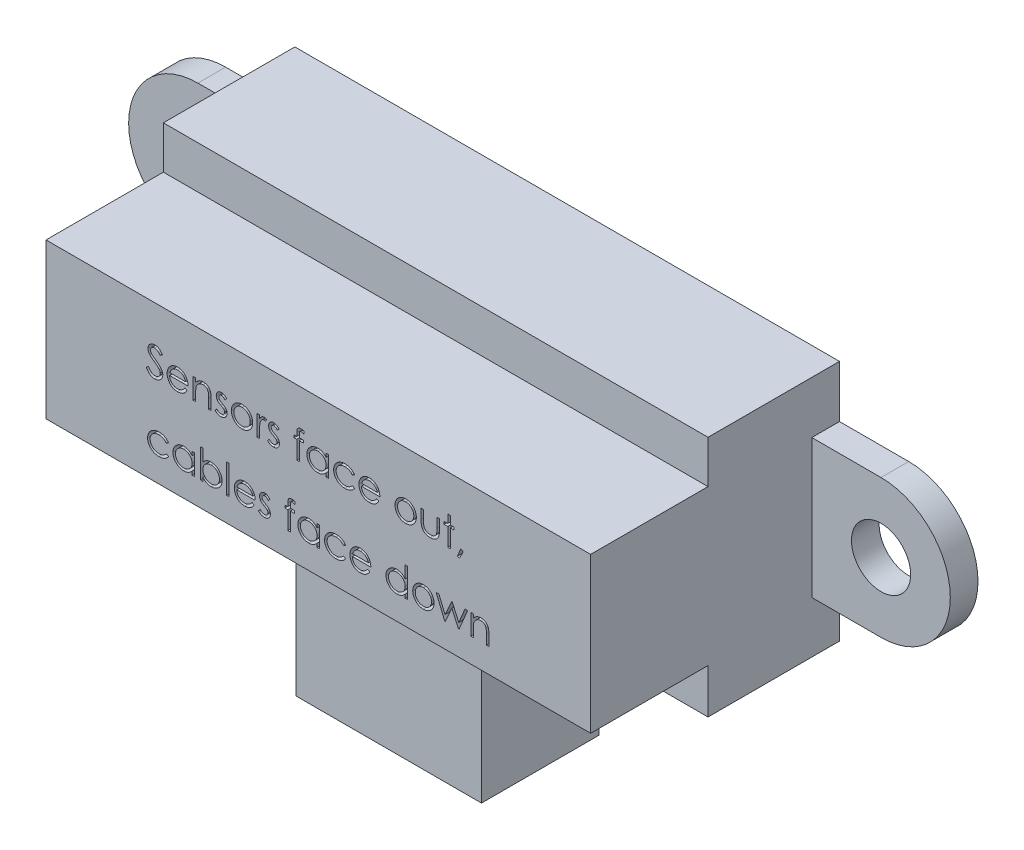
from build123d import *

# Parameters (mm, degrees)
SKETCH1_R           = 1.6002
BOSS_EXTRUDE1_DEPTH = 1.4986
SKETCH2_W           = 29.464
SKETCH2_H           = 13.1064
BOSS_EXTRUDE2_DEPTH = 7.112
SKETCH3_W           = 29.464
SKETCH3_H           = 8.382
BOSS_EXTRUDE3_DEPTH = 6.35
SKETCH6_W           = 0.13676923
SKETCH6_H           = 1.563076923
CUT_EXTRUDE1_DEPTH  = 1.27
SKETCH7_W           = 10.0457
SKETCH7_H           = 6.35
BOSS_EXTRUDE4_DEPTH = 10.16


with BuildPart() as part:
    # Sketch1 → Boss-Extrude1 (new body)
    with BuildSketch(Plane.XY):
        with BuildLine():
            Line((0, 0), (29.464, 0))
            Line((29.464, 0), (29.464, -2.8194))
            Line((29.464, -2.8194), (33.210500366, -2.8194))
            ThreePointArc((33.210500366, -2.8194), (36.957000366, -6.5659), (33.210500366, -10.3124))
            Line((33.210500366, -10.3124), (29.464, -10.3124))
            Line((29.464, -10.3124), (29.464, -13.1064))
            Line((29.464, -13.1064), (0, -13.1064))
            Line((0, -13.1064), (0, -10.3124))
            Line((0, -10.3124), (-3.746500366, -10.3124))
            ThreePointArc((-3.746500366, -10.3124), (-7.492999634, -6.565899634), (-3.746499634, -2.8194))
            Line((-3.746499634, -2.8194), (0, -2.8194))
            Line((0, -2.8194), (0, 0))
        make_face()
        with Locations((-3.746499634, -6.5659)):
            Circle(SKETCH1_R, mode=Mode.SUBTRACT)
        with Locations((33.210500366, -6.5659)):
            Circle(SKETCH1_R, mode=Mode.SUBTRACT)
    extrude(amount=-BOSS_EXTRUDE1_DEPTH)

    # Sketch2 → Boss-Extrude2 (add)
    with BuildSketch(Plane(origin=(0, 0, -1.4986), x_dir=(-1, 0, 0), z_dir=(0, 0, -1))):
        with Locations((-14.732, -6.5532)):
            Rectangle(SKETCH2_W, SKETCH2_H)
    extrude(amount=-BOSS_EXTRUDE2_DEPTH)

    # Sketch3 → Boss-Extrude3 (add)
    with BuildSketch(Plane.XY.offset(5.6134)):
        with Locations((14.732, -6.5024)):
            Rectangle(SKETCH3_W, SKETCH3_H)
    extrude(amount=BOSS_EXTRUDE3_DEPTH)

    # Sketch6 → Cut-Extrude1 (cut)
    # profile 1 of 29: a face of its own
    with BuildSketch(Plane.XY.offset(11.9634)):
        with BuildLine():
            Line((5.419430222, -5.550749128), (5.548261953, -5.473511147))
            add(Edge.make_bspline(
                [(5.548261953, -5.473511147), (5.56024418, -5.493568897), (5.583201664, -5.53199877), (5.621498199, -5.583927129), (5.661180072, -5.628063108), (5.702541142, -5.664149951), (5.745328943, -5.69256118), (5.7898228, -5.712678952), (5.835872772, -5.725226251), (5.86721223, -5.726750288), (5.882858107, -5.727511147)],
                knots=[0, 0, 0, 0, 1.272034388, 2.437168799, 3.508375237, 4.49857839, 5.41946034, 6.295179144, 7.148887113, 8, 8, 8, 8], degree=3))
            add(Edge.make_bspline(
                [(5.882858107, -5.727511147), (5.896220043, -5.727138999), (5.922710112, -5.726401213), (5.961708072, -5.719312086), (5.999582433, -5.708421091), (6.035552595, -5.692823634), (6.069122228, -5.673952819), (6.098560115, -5.651159797), (6.124009222, -5.625640981), (6.144826677, -5.597171505), (6.160798212, -5.56655341), (6.173073844, -5.535125938), (6.179886156, -5.502395396), (6.180912354, -5.480358154), (6.181430222, -5.469237109)],
                knots=[0, 0, 0, 0, 1.095163259, 2.171163733, 3.241058638, 4.321873601, 5.38011039, 6.391990106, 7.366004449, 8.327778327, 9.272591725, 10.192022065, 11.087607919, 12, 12, 12, 12], degree=3))
            add(Edge.make_bspline(
                [(6.181430222, -5.469237109), (6.180788265, -5.45654835), (6.179483261, -5.430753958), (6.16845321, -5.392697652), (6.15110171, -5.355036316), (6.135094204, -5.331740337), (6.126783588, -5.319645763)],
                knots=[0, 0, 0, 0, 0.938893495, 1.908633276, 2.914225137, 4, 4, 4, 4], degree=3))
            add(Edge.make_bspline(
                [(6.126783588, -5.319645763), (6.119960155, -5.310916803), (6.10563521, -5.292591444), (6.081008453, -5.265313918), (6.052110751, -5.237177213), (6.019931032, -5.207106926), (5.983297081, -5.176501611), (5.9433563, -5.143901824), (5.899088952, -5.110547309), (5.868043114, -5.088178226), (5.852023972, -5.076636147)],
                knots=[0, 0, 0, 0, 0.722233717, 1.516239348, 2.393582979, 3.351407094, 4.387010283, 5.505090956, 6.712668013, 8, 8, 8, 8], degree=3))
            add(Edge.make_bspline(
                [(5.852023972, -5.076636147), (5.835989752, -5.065215471), (5.805333545, -5.043380007), (5.762461865, -5.010973548), (5.72412479, -4.981345303), (5.690492715, -4.954216356), (5.661580434, -4.929583027), (5.637160114, -4.907681867), (5.61785384, -4.887920568), (5.607118095, -4.875100967), (5.602298011, -4.869345282)],
                knots=[0, 0, 0, 0, 1.452282411, 2.77665338, 3.964542531, 5.026858415, 5.96415736, 6.766646006, 7.446254459, 8, 8, 8, 8], degree=3))
            add(Edge.make_bspline(
                [(5.602298011, -4.869345282), (5.595560823, -4.860375002), (5.582311238, -4.842733742), (5.564821811, -4.81516029), (5.549956644, -4.786934388), (5.53830356, -4.757980189), (5.528490647, -4.72870418), (5.521890451, -4.69872438), (5.517757625, -4.668175313), (5.517334395, -4.647617206), (5.51712253, -4.637326051)],
                knots=[0, 0, 0, 0, 1.068054152, 2.10047183, 3.106115577, 4.101338837, 5.06977816, 6.043150881, 7.020423561, 8, 8, 8, 8], degree=3))
            add(Edge.make_bspline(
                [(5.51712253, -4.637326051), (5.517690855, -4.621202229), (5.518815358, -4.589299221), (5.528325344, -4.542694939), (5.543335827, -4.498200054), (5.564364801, -4.456255074), (5.591473431, -4.417952173), (5.622844306, -4.382850757), (5.660209079, -4.35334238), (5.701205822, -4.327559758), (5.74607951, -4.307379418), (5.793101835, -4.292156409), (5.842347532, -4.283530892), (5.875702725, -4.282293071), (5.892627338, -4.281664994)],
                knots=[0, 0, 0, 0, 1.005424448, 1.989358655, 2.955360095, 3.929531133, 4.905563448, 5.876582895, 6.856512386, 7.866279853, 8.892233794, 9.918561126, 10.94386622, 12, 12, 12, 12], degree=3))
            add(Edge.make_bspline(
                [(5.892627338, -4.281664994), (5.910586198, -4.282284413), (5.946300638, -4.283516241), (5.998834753, -4.294226709), (6.049414448, -4.311948944), (6.090102315, -4.332060806), (6.121946409, -4.352147742), (6.14623145, -4.370444374), (6.170840763, -4.391508279), (6.195972853, -4.415395562), (6.221201872, -4.442325404), (6.246902369, -4.472113373), (6.273134445, -4.504577427), (6.290009854, -4.527752896), (6.298660992, -4.539633744)],
                knots=[0, 0, 0, 0, 1.286793592, 2.559021753, 3.825965368, 5.121522368, 5.803751409, 6.523245864, 7.299691795, 8.125521123, 9.008227632, 9.944561021, 10.946284179, 12, 12, 12, 12], degree=3))
            Line((6.298660992, -4.539633744), (6.175019165, -4.633357301))
            add(Edge.make_bspline(
                [(6.175019165, -4.633357301), (6.167553336, -4.623739254), (6.153175895, -4.605217145), (6.131348084, -4.579278092), (6.110774673, -4.555583602), (6.090505299, -4.535003015), (6.071610472, -4.516409286), (6.053271508, -4.500490123), (6.035752322, -4.48708955), (6.01366873, -4.472788525), (5.985924215, -4.458612493), (5.951096663, -4.446616838), (5.914700811, -4.439408291), (5.889912022, -4.438455187), (5.877362915, -4.437972686)],
                knots=[0, 0, 0, 0, 1.181633172, 2.275549214, 3.290209073, 4.226197932, 5.078386478, 5.862611352, 6.581680152, 7.217281963, 8.414376989, 9.595101626, 10.782541182, 12, 12, 12, 12], degree=3))
            add(Edge.make_bspline(
                [(5.877362915, -4.437972686), (5.861619332, -4.438500295), (5.831259315, -4.439517738), (5.788156138, -4.450629869), (5.749362098, -4.468126199), (5.716028924, -4.49264735), (5.688276023, -4.521699576), (5.668200389, -4.555131283), (5.656117174, -4.592047964), (5.654642691, -4.617799931), (5.653891761, -4.630914994)],
                knots=[0, 0, 0, 0, 1.14458467, 2.207223713, 3.21896685, 4.227309161, 5.202851033, 6.127160689, 7.046193047, 8, 8, 8, 8], degree=3))
            add(Edge.make_bspline(
                [(5.653891761, -4.630914994), (5.654062939, -4.639079923), (5.654405577, -4.655423133), (5.659184317, -4.679568267), (5.665323568, -4.703652404), (5.675052188, -4.727567266), (5.688483114, -4.751731096), (5.706120225, -4.776559989), (5.728332879, -4.80227279), (5.745348127, -4.818996458), (5.754331665, -4.827826051)],
                knots=[0, 0, 0, 0, 0.858281714, 1.717966888, 2.583508476, 3.4729293, 4.427298488, 5.488583878, 6.674047936, 8, 8, 8, 8], degree=3))
            add(Edge.make_bspline(
                [(5.754331665, -4.827826051), (5.757667645, -4.830803088), (5.765593171, -4.837875845), (5.78008246, -4.849454883), (5.79921641, -4.863738148), (5.82249538, -4.881411025), (5.850348597, -4.901911639), (5.882779123, -4.924977863), (5.919425459, -4.951358503), (5.945430088, -4.969802186), (5.959180222, -4.979554417)],
                knots=[0, 0, 0, 0, 0.420754252, 0.999615792, 1.744751191, 2.668019286, 3.750313428, 4.999500688, 6.413464383, 8, 8, 8, 8], degree=3))
            add(Edge.make_bspline(
                [(5.959180222, -4.979554417), (5.975720374, -4.991590254), (6.007748086, -5.014895986), (6.053318987, -5.049911271), (6.094638462, -5.084156756), (6.131851583, -5.117413748), (6.165325985, -5.149429981), (6.194690296, -5.180590634), (6.220243717, -5.210672467), (6.247753754, -5.249239497), (6.275864073, -5.296605889), (6.30000489, -5.354639042), (6.315226753, -5.412897782), (6.317217322, -5.452054496), (6.318199453, -5.471374128)],
                knots=[0, 0, 0, 0, 1.163667725, 2.253281268, 3.268753668, 4.215851969, 5.092017293, 5.902905408, 6.650798638, 7.335211899, 8.59617414, 9.77448103, 10.901945474, 12, 12, 12, 12], degree=3))
            add(Edge.make_bspline(
                [(6.318199453, -5.471374128), (6.317913317, -5.485037165), (6.3173466, -5.512097911), (6.31083219, -5.551832979), (6.301287742, -5.590425392), (6.286902386, -5.627398116), (6.269344531, -5.66342755), (6.247065285, -5.69756859), (6.221241024, -5.730576862), (6.191617179, -5.761572188), (6.159201306, -5.790025789), (6.124940178, -5.815336843), (6.088777716, -5.836441336), (6.050910097, -5.853662902), (6.011328622, -5.86713224), (5.970046604, -5.876891443), (5.926995994, -5.882881073), (5.897734985, -5.883502761), (5.882858107, -5.88381884)],
                knots=[0, 0, 0, 0, 0.983748083, 1.948392443, 2.894712957, 3.844097841, 4.80183111, 5.778335162, 6.776009319, 7.81870978, 8.863265674, 9.881300176, 10.883814829, 11.87499822, 12.874611388, 13.892143829, 14.928324115, 16, 16, 16, 16], degree=3))
            add(Edge.make_bspline(
                [(5.882858107, -5.88381884), (5.871347403, -5.883596257), (5.848470962, -5.883153894), (5.814634033, -5.879243188), (5.78148068, -5.873710152), (5.749426919, -5.864925785), (5.718059771, -5.85426781), (5.687515661, -5.841144719), (5.657779785, -5.825418257), (5.628685501, -5.807437224), (5.600306803, -5.786511509), (5.572909869, -5.762139049), (5.545595789, -5.734992035), (5.519170763, -5.704333264), (5.493100285, -5.670658053), (5.467898372, -5.633651334), (5.443043361, -5.593514681), (5.427448283, -5.565270569), (5.419430222, -5.550749128)],
                knots=[0, 0, 0, 0, 0.915332311, 1.819136955, 2.706846663, 3.586547465, 4.459518054, 5.340707479, 6.227863349, 7.133153174, 8.059268498, 9.028702269, 10.047606654, 11.120612155, 12.245963614, 13.433783089, 14.680604001, 16, 16, 16, 16], degree=3))
        make_face()
    # profile 2 of 29: a face of its own
    with BuildSketch(Plane.XY.offset(11.9634)):
        with BuildLine():
            Line((7.505771569, -5.493049609), (7.627276376, -5.556854897))
            add(Edge.make_bspline(
                [(7.627276376, -5.556854897), (7.617593927, -5.574029651), (7.598755716, -5.60744492), (7.566359505, -5.653352964), (7.532399528, -5.694652369), (7.495342829, -5.730239796), (7.456298089, -5.761264685), (7.415048784, -5.788408355), (7.371380167, -5.811537676), (7.325290173, -5.831024205), (7.27639174, -5.846007082), (7.224566371, -5.856589834), (7.169714783, -5.863131395), (7.132117189, -5.863891279), (7.112865319, -5.864280378)],
                knots=[0, 0, 0, 0, 1.120438281, 2.179929193, 3.190490725, 4.156257408, 5.095198341, 6.022838206, 6.959905092, 7.901321166, 8.864066838, 9.862729781, 10.905609505, 12, 12, 12, 12], degree=3))
            add(Edge.make_bspline(
                [(7.112865319, -5.864280378), (7.091467498, -5.863780865), (7.049726548, -5.86280646), (6.988966955, -5.85440597), (6.931760602, -5.840702006), (6.878110706, -5.821558153), (6.828148651, -5.796552655), (6.781775136, -5.766090298), (6.738746291, -5.730327568), (6.700418036, -5.688954693), (6.665912985, -5.644679464), (6.635465285, -5.598543245), (6.610011249, -5.550662115), (6.589305484, -5.501340892), (6.572582909, -5.450890443), (6.560927921, -5.398851735), (6.554209368, -5.345365612), (6.553179821, -5.309182658), (6.552660992, -5.290948647)],
                knots=[0, 0, 0, 0, 1.145258523, 2.234067595, 3.276747158, 4.290159414, 5.277019952, 6.260822364, 7.254936242, 8.264827045, 9.274100331, 10.257902744, 11.220704747, 12.172965371, 13.118907548, 14.062713208, 15.023725156, 16, 16, 16, 16], degree=3))
            add(Edge.make_bspline(
                [(6.552660992, -5.290948647), (6.553122172, -5.273838556), (6.554036171, -5.239928613), (6.559797234, -5.189738702), (6.57000729, -5.140958313), (6.584017781, -5.093546913), (6.602110381, -5.047583885), (6.624244181, -5.003041257), (6.650453663, -4.959966424), (6.670689192, -4.932794317), (6.680882146, -4.919107301)],
                knots=[0, 0, 0, 0, 1.024358464, 2.0301432, 3.019427413, 4.004406732, 4.986367066, 5.972626655, 6.978780325, 8, 8, 8, 8], degree=3))
            add(Edge.make_bspline(
                [(6.680882146, -4.919107301), (6.694688577, -4.902618113), (6.721864086, -4.870162073), (6.767826339, -4.827516928), (6.81759591, -4.791792724), (6.870549087, -4.762180474), (6.927301311, -4.739680291), (6.9870897, -4.72291299), (7.050595035, -4.713517307), (7.094009537, -4.712190193), (7.116223492, -4.711511147)],
                knots=[0, 0, 0, 0, 1.030682036, 2.02871468, 2.997146059, 3.962720338, 4.930598197, 5.918074684, 6.934738563, 8, 8, 8, 8], degree=3))
            add(Edge.make_bspline(
                [(7.116223492, -4.711511147), (7.139060678, -4.712100739), (7.18386203, -4.713257383), (7.249190302, -4.723980392), (7.311004054, -4.74098499), (7.369278551, -4.765000527), (7.424019699, -4.795985429), (7.474871682, -4.834364905), (7.522704169, -4.878960666), (7.55053179, -4.913256418), (7.564692242, -4.930708263)],
                knots=[0, 0, 0, 0, 1.056321875, 2.072262726, 3.055038591, 4.01806755, 4.982017516, 5.957941055, 6.960871419, 8, 8, 8, 8], degree=3))
            add(Edge.make_bspline(
                [(7.564692242, -4.930708263), (7.574326943, -4.943859765), (7.593532214, -4.970075229), (7.617588379, -5.012821756), (7.638470399, -5.057544883), (7.655161666, -5.104967538), (7.668677152, -5.154527836), (7.678455492, -5.206580075), (7.68418992, -5.261108757), (7.685317113, -5.298262377), (7.685891761, -5.317203455)],
                knots=[0, 0, 0, 0, 0.94817472, 1.890038105, 2.849395472, 3.817997239, 4.812318967, 5.836947057, 6.897266129, 8, 8, 8, 8], degree=3))
            Line((7.685891761, -5.317203455), (6.689430222, -5.317203455))
            add(Edge.make_bspline(
                [(6.689430222, -5.317203455), (6.690100611, -5.3318776), (6.691418903, -5.360733714), (6.69756504, -5.402957564), (6.707252792, -5.443179556), (6.720868235, -5.481098001), (6.737356541, -5.517208148), (6.757554208, -5.551242132), (6.781650631, -5.583044934), (6.808527764, -5.612901024), (6.838444796, -5.639488624), (6.869918769, -5.663285569), (6.903400425, -5.683230635), (6.938625762, -5.699419821), (6.975537819, -5.712093543), (7.014148226, -5.720744559), (7.054381006, -5.726538854), (7.081806794, -5.727183142), (7.095769165, -5.727511147)],
                knots=[0, 0, 0, 0, 1.094153842, 2.151609401, 3.174256925, 4.172055639, 5.149267565, 6.128595816, 7.11444997, 8.118368179, 9.117203808, 10.09244225, 11.054858984, 12.015122123, 12.976791628, 13.957293641, 14.960065497, 16, 16, 16, 16], degree=3))
            add(Edge.make_bspline(
                [(7.095769165, -5.727511147), (7.10942035, -5.727246382), (7.136506921, -5.726721037), (7.176845397, -5.721612628), (7.216530151, -5.713352428), (7.255396934, -5.702079186), (7.292656925, -5.688329723), (7.327162701, -5.67173865), (7.35889683, -5.653385446), (7.388556903, -5.632393576), (7.417326101, -5.606699726), (7.445865173, -5.574636629), (7.476465635, -5.536716231), (7.495619961, -5.508175775), (7.505771569, -5.493049609)],
                knots=[0, 0, 0, 0, 0.99110716, 1.966546729, 2.947904876, 3.932708344, 4.903319531, 5.828989031, 6.710028674, 7.56322171, 8.463672341, 9.504779593, 10.677557249, 12, 12, 12, 12], degree=3))
        make_face()
        with BuildLine():
            add(Edge.make_bspline(
                [(7.54912253, -5.180434224), (7.544116571, -5.162293019), (7.534481712, -5.127377038), (7.514349078, -5.079026661), (7.491675641, -5.03605513), (7.464843779, -4.998791312), (7.434442711, -4.965697211), (7.399327494, -4.936776661), (7.359949122, -4.910904606), (7.316511142, -4.889066774), (7.270511691, -4.87047839), (7.222350595, -4.858014197), (7.173209089, -4.849475642), (7.13997096, -4.848680502), (7.123245126, -4.848280378)],
                knots=[0, 0, 0, 0, 1.154881502, 2.222775134, 3.210006277, 4.132804581, 5.035138423, 5.962687519, 6.919655026, 7.923214229, 8.944639381, 9.960483929, 10.97369054, 12, 12, 12, 12], degree=3))
            add(Edge.make_bspline(
                [(7.123245126, -4.848280378), (7.109594685, -4.848546717), (7.082610633, -4.849073214), (7.042855539, -4.854067636), (7.004677293, -4.862323294), (6.967794191, -4.873629178), (6.932689561, -4.888698753), (6.898641325, -4.906369849), (6.866515232, -4.92794167), (6.846423994, -4.944382954), (6.836273972, -4.952689032)],
                knots=[0, 0, 0, 0, 1.04873581, 2.073130211, 3.073294108, 4.04793562, 5.032784715, 6.005352987, 6.992311501, 8, 8, 8, 8], degree=3))
            add(Edge.make_bspline(
                [(6.836273972, -4.952689032), (6.829005241, -4.959261528), (6.814295099, -4.972562659), (6.794639626, -4.995478919), (6.775820197, -5.020190171), (6.758693201, -5.047641819), (6.742983989, -5.077521267), (6.72828393, -5.109576489), (6.715052818, -5.144050732), (6.707608684, -5.168074388), (6.70377878, -5.180434224)],
                knots=[0, 0, 0, 0, 0.879870761, 1.780643979, 2.707998968, 3.669668524, 4.684282772, 5.740141944, 6.837334558, 8, 8, 8, 8], degree=3))
            Line((6.70377878, -5.180434224), (7.54912253, -5.180434224))
        make_face(mode=Mode.SUBTRACT)
    # profile 3 of 29: a face of its own
    with BuildSketch(Plane.XY.offset(11.9634)):
        with BuildLine():
            Line((7.959430222, -4.731049609), (8.096199453, -4.731049609))
            Line((8.096199453, -4.731049609), (8.096199453, -4.931929417))
            add(Edge.make_bspline(
                [(8.096199453, -4.931929417), (8.110802698, -4.9137099), (8.139140803, -4.878354291), (8.186334439, -4.831885104), (8.236210126, -4.79359124), (8.288462427, -4.763066045), (8.343162274, -4.740055114), (8.399976241, -4.723436577), (8.459244473, -4.713471869), (8.499549674, -4.712169838), (8.519939838, -4.711511147)],
                knots=[0, 0, 0, 0, 1.12780773, 2.188550248, 3.19190651, 4.159438251, 5.104880172, 6.052711206, 7.014878035, 8, 8, 8, 8], degree=3))
            add(Edge.make_bspline(
                [(8.519939838, -4.711511147), (8.540548948, -4.712271055), (8.580885948, -4.713758379), (8.63961571, -4.725522218), (8.694468125, -4.74561518), (8.745247611, -4.773139522), (8.791023004, -4.807367026), (8.831223882, -4.847242609), (8.864474622, -4.893108949), (8.886767416, -4.935660403), (8.901452527, -4.973407181), (8.910697693, -5.005736338), (8.918548898, -5.041754184), (8.925355408, -5.081351879), (8.929960984, -5.124806863), (8.933593456, -5.171941001), (8.936196751, -5.222739025), (8.936300037, -5.257872288), (8.936353299, -5.275989513)],
                knots=[0, 0, 0, 0, 1.235846778, 2.418850247, 3.575807741, 4.728682307, 5.871620074, 6.994088408, 8.11269785, 9.256955736, 9.865816715, 10.540099792, 11.271859618, 12.076849838, 12.949306005, 13.892391288, 14.913166135, 16, 16, 16, 16], degree=3))
            Line((8.936353299, -5.275989513), (8.936353299, -5.844741917))
            Line((8.936353299, -5.844741917), (8.799584069, -5.844741917))
            Line((8.799584069, -5.844741917), (8.799584069, -5.320866917))
            add(Edge.make_bspline(
                [(8.799584069, -5.320866917), (8.79949994, -5.305704229), (8.799339017, -5.276700589), (8.798831461, -5.235174191), (8.797607991, -5.197515464), (8.795888783, -5.163814439), (8.793372428, -5.134103477), (8.790750002, -5.108322066), (8.787543081, -5.086502939), (8.784685401, -5.073368201), (8.78340378, -5.067477494)],
                knots=[0, 0, 0, 0, 1.430800155, 2.736877192, 3.918605307, 4.986035426, 5.920637409, 6.731861385, 7.431261377, 8, 8, 8, 8], degree=3))
            add(Edge.make_bspline(
                [(8.78340378, -5.067477494), (8.77877712, -5.050186109), (8.769872231, -5.016905544), (8.747868291, -4.971762768), (8.720081773, -4.933358757), (8.686162824, -4.901930951), (8.646439078, -4.877472563), (8.601020768, -4.86050219), (8.550346183, -4.849888066), (8.514704446, -4.848831223), (8.496127338, -4.848280378)],
                knots=[0, 0, 0, 0, 1.084156227, 2.086665306, 3.027808233, 3.945421172, 4.874247719, 5.839848303, 6.874090471, 8, 8, 8, 8], degree=3))
            add(Edge.make_bspline(
                [(8.496127338, -4.848280378), (8.485125066, -4.848487644), (8.463351856, -4.848897818), (8.431064839, -4.853013184), (8.399746999, -4.859744237), (8.369084028, -4.868831038), (8.339689206, -4.881311409), (8.310618126, -4.895475626), (8.282965467, -4.913131476), (8.256141587, -4.932808764), (8.231185953, -4.954614681), (8.207965271, -4.977624691), (8.187265859, -5.002128697), (8.168512527, -5.027731874), (8.152324049, -5.054785851), (8.138193047, -5.083029624), (8.126203219, -5.112500365), (8.120245384, -5.132954649), (8.117264357, -5.143189032)],
                knots=[0, 0, 0, 0, 1.023777757, 2.026029729, 3.023749952, 4.003683103, 4.997618607, 5.993177895, 7.010360494, 8.046726602, 9.087585522, 10.09234134, 11.086953743, 12.070360549, 13.043493632, 14.017870808, 15.008233677, 16, 16, 16, 16], degree=3))
            add(Edge.make_bspline(
                [(8.117264357, -5.143189032), (8.115548922, -5.15070244), (8.111814508, -5.167058738), (8.107781055, -5.193900479), (8.104120156, -5.22495088), (8.101056064, -5.260173706), (8.099181362, -5.299692277), (8.097137288, -5.343337825), (8.096393114, -5.391284384), (8.096265814, -5.424665075), (8.096199453, -5.442066436)],
                knots=[0, 0, 0, 0, 0.615963638, 1.340920617, 2.168419149, 3.115676021, 4.16674242, 5.331190069, 6.6087489, 8, 8, 8, 8], degree=3))
            Line((8.096199453, -5.442066436), (8.096199453, -5.844741917))
            Line((8.096199453, -5.844741917), (7.959430222, -5.844741917))
            Line((7.959430222, -5.844741917), (7.959430222, -4.731049609))
        make_face()
    # profile 4 of 29: a face of its own
    with BuildSketch(Plane.XY.offset(11.9634)):
        with BuildLine():
            Line((9.776507146, -4.869955859), (9.683699453, -4.965511147))
            add(Edge.make_bspline(
                [(9.683699453, -4.965511147), (9.675691703, -4.956230795), (9.660253702, -4.938339367), (9.635768908, -4.914418198), (9.611374631, -4.894328857), (9.587404805, -4.87736793), (9.56325669, -4.864544931), (9.539213666, -4.855185454), (9.515250839, -4.849393467), (9.499233148, -4.848646952), (9.491367722, -4.848280378)],
                knots=[0, 0, 0, 0, 1.26578478, 2.440284043, 3.530471711, 4.527705817, 5.468200915, 6.346673037, 7.188140097, 8, 8, 8, 8], degree=3))
            add(Edge.make_bspline(
                [(9.491367722, -4.848280378), (9.4817276, -4.848748409), (9.462757202, -4.849669426), (9.435575217, -4.858862817), (9.410341859, -4.872974508), (9.388502077, -4.892990542), (9.370001727, -4.915965613), (9.356497484, -4.941654298), (9.348239153, -4.969281389), (9.347192064, -4.988453247), (9.346660992, -4.998177013)],
                knots=[0, 0, 0, 0, 0.99966794, 1.967205029, 2.953328237, 3.988086729, 5.028030931, 6.008226631, 6.989793394, 8, 8, 8, 8], degree=3))
            add(Edge.make_bspline(
                [(9.346660992, -4.998177013), (9.347144671, -5.006977914), (9.348110666, -5.024554908), (9.355620363, -5.050483823), (9.367579876, -5.075763516), (9.378757412, -5.091248622), (9.384516761, -5.099227494)],
                knots=[0, 0, 0, 0, 0.960159726, 1.917612774, 2.927026955, 4, 4, 4, 4], degree=3))
            add(Edge.make_bspline(
                [(9.384516761, -5.099227494), (9.387984294, -5.103487981), (9.3953645, -5.112555892), (9.409214836, -5.125141456), (9.424900063, -5.139050024), (9.443762802, -5.152956236), (9.464990392, -5.16760045), (9.489043155, -5.18240595), (9.515157768, -5.198501317), (9.533853898, -5.208709694), (9.543572049, -5.214015955)],
                knots=[0, 0, 0, 0, 0.66740084, 1.420478572, 2.27185888, 3.217733974, 4.268547843, 5.408967954, 6.65319498, 8, 8, 8, 8], degree=3))
            add(Edge.make_bspline(
                [(9.543572049, -5.214015955), (9.555421618, -5.220654021), (9.578311084, -5.23347658), (9.610834449, -5.25337989), (9.640350863, -5.273162031), (9.667110417, -5.292611438), (9.690598222, -5.312272287), (9.711526901, -5.331390978), (9.729374441, -5.35054518), (9.739369236, -5.363927256), (9.744146569, -5.370323647)],
                knots=[0, 0, 0, 0, 1.27191281, 2.456916733, 3.569705269, 4.599008579, 5.553216877, 6.436649441, 7.252746552, 8, 8, 8, 8], degree=3))
            add(Edge.make_bspline(
                [(9.744146569, -5.370323647), (9.752075953, -5.38324111), (9.767856898, -5.408949257), (9.784428555, -5.451280938), (9.794034229, -5.496178197), (9.795367607, -5.526889941), (9.796045607, -5.54250634)],
                knots=[0, 0, 0, 0, 0.995354457, 1.980940102, 2.973342416, 4, 4, 4, 4], degree=3))
            add(Edge.make_bspline(
                [(9.796045607, -5.54250634), (9.795732301, -5.553509248), (9.795114899, -5.575191681), (9.790822415, -5.607123761), (9.783439733, -5.637662351), (9.773384053, -5.667138812), (9.759805486, -5.694988362), (9.743891531, -5.721913631), (9.724787141, -5.747332179), (9.702975925, -5.77121063), (9.67909463, -5.793019395), (9.653619386, -5.812188682), (9.62651882, -5.828114194), (9.597986579, -5.84129259), (9.567957834, -5.851772597), (9.536427889, -5.859027939), (9.503496969, -5.863370364), (9.481102961, -5.863973205), (9.469692242, -5.864280378)],
                knots=[0, 0, 0, 0, 1.032770009, 2.035186124, 3.017557409, 3.978232242, 4.952395191, 5.920591857, 6.910227898, 7.931268572, 8.952309245, 9.941945286, 10.918353717, 11.897095711, 12.887975737, 13.898235213, 14.929059601, 16, 16, 16, 16], degree=3))
            add(Edge.make_bspline(
                [(9.469692242, -5.864280378), (9.454292363, -5.863848128), (9.423706586, -5.862989634), (9.378470034, -5.854931566), (9.334264995, -5.842393229), (9.29142599, -5.825099776), (9.250911054, -5.803262723), (9.213842617, -5.777109841), (9.180091912, -5.747505054), (9.160881555, -5.724813603), (9.151276376, -5.713467878)],
                knots=[0, 0, 0, 0, 1.013940152, 2.01379169, 3.017749504, 4.037548394, 5.051665909, 6.043208538, 7.021604269, 8, 8, 8, 8], degree=3))
            Line((9.151276376, -5.713467878), (9.241947049, -5.610280378))
            add(Edge.make_bspline(
                [(9.241947049, -5.610280378), (9.250556523, -5.619578853), (9.267247289, -5.637605352), (9.29393959, -5.661608065), (9.321101364, -5.681725418), (9.348461382, -5.698551865), (9.376424646, -5.711516926), (9.40483445, -5.72062548), (9.43363301, -5.726479465), (9.452975677, -5.727166694), (9.462670607, -5.727511147)],
                knots=[0, 0, 0, 0, 1.179806542, 2.287233372, 3.337373186, 4.324005949, 5.273901747, 6.200048787, 7.097828587, 8, 8, 8, 8], degree=3))
            add(Edge.make_bspline(
                [(9.462670607, -5.727511147), (9.475871898, -5.726914251), (9.501665007, -5.725748016), (9.538608403, -5.715159659), (9.57271928, -5.698556789), (9.602338588, -5.675006766), (9.627550843, -5.647594111), (9.645807568, -5.616716077), (9.657248966, -5.583278883), (9.658592698, -5.560100017), (9.659276376, -5.54830682)],
                knots=[0, 0, 0, 0, 1.072336372, 2.095165389, 3.102688358, 4.141489647, 5.156069229, 6.117746104, 7.042326257, 8, 8, 8, 8], degree=3))
            add(Edge.make_bspline(
                [(9.659276376, -5.54830682), (9.658803373, -5.538592575), (9.65786949, -5.519413098), (9.650535449, -5.491654378), (9.638947452, -5.465324326), (9.6275372, -5.449914662), (9.621725896, -5.442066436)],
                knots=[0, 0, 0, 0, 1.013901739, 2.00181326, 2.98231254, 4, 4, 4, 4], degree=3))
            add(Edge.make_bspline(
                [(9.621725896, -5.442066436), (9.618232716, -5.438132181), (9.610623309, -5.429561953), (9.596665541, -5.417184862), (9.579952981, -5.403844158), (9.560297665, -5.38976606), (9.537659968, -5.375136268), (9.511948139, -5.360031532), (9.483514413, -5.343734431), (9.4634104, -5.332927244), (9.452901376, -5.327277974)],
                knots=[0, 0, 0, 0, 0.615000592, 1.339693406, 2.178160186, 3.116406724, 4.166410947, 5.330106347, 6.604359322, 8, 8, 8, 8], degree=3))
            add(Edge.make_bspline(
                [(9.452901376, -5.327277974), (9.441559925, -5.320947221), (9.419565232, -5.30866987), (9.388411497, -5.289547554), (9.360305735, -5.270098146), (9.334571656, -5.25141267), (9.311859264, -5.23250595), (9.292258034, -5.213356999), (9.274996245, -5.194738079), (9.265439715, -5.18154577), (9.260874934, -5.17524432)],
                knots=[0, 0, 0, 0, 1.262093308, 2.447601706, 3.550203992, 4.582594899, 5.537233252, 6.418365656, 7.244515135, 8, 8, 8, 8], degree=3))
            add(Edge.make_bspline(
                [(9.260874934, -5.17524432), (9.252980353, -5.162553487), (9.237188432, -5.137167385), (9.221854731, -5.094795623), (9.211314735, -5.050188118), (9.210373168, -5.019409042), (9.209891761, -5.003672205)],
                knots=[0, 0, 0, 0, 0.985009483, 1.970363186, 2.962279964, 4, 4, 4, 4], degree=3))
            add(Edge.make_bspline(
                [(9.209891761, -5.003672205), (9.210124365, -4.993385032), (9.210579604, -4.973251576), (9.214212842, -4.943669073), (9.220827747, -4.915562962), (9.229124805, -4.888511151), (9.240656262, -4.863037668), (9.254435793, -4.838802815), (9.27062826, -4.815840089), (9.289283453, -4.794502726), (9.309795032, -4.775122093), (9.331956069, -4.758228062), (9.355268156, -4.743812609), (9.379829993, -4.731722865), (9.405877537, -4.722578263), (9.433228715, -4.716283105), (9.461828166, -4.712078953), (9.4813794, -4.711703142), (9.491367722, -4.711511147)],
                knots=[0, 0, 0, 0, 1.087655834, 2.128696564, 3.144119009, 4.137814668, 5.115653402, 6.093965665, 7.082169637, 8.081268856, 9.086088321, 10.061021666, 11.022561449, 11.980240094, 12.950172527, 13.934149372, 14.944599409, 16, 16, 16, 16], degree=3))
            add(Edge.make_bspline(
                [(9.491367722, -4.711511147), (9.503207924, -4.711992009), (9.527110436, -4.712962752), (9.562969994, -4.720672316), (9.59877674, -4.733357702), (9.634622679, -4.750877707), (9.670245216, -4.773549113), (9.705957699, -4.800950328), (9.742188853, -4.832901081), (9.764812116, -4.857328287), (9.776507146, -4.869955859)],
                knots=[0, 0, 0, 0, 0.845714091, 1.707292901, 2.609013841, 3.555613372, 4.552488639, 5.621697636, 6.770543573, 8, 8, 8, 8], degree=3))
        make_face()
    # profile 5 of 29: a face of its own
    with BuildSketch(Plane.XY.offset(11.9634)):
        with BuildLine():
            add(Edge.make_bspline(
                [(10.607502338, -4.711511147), (10.628399109, -4.711956108), (10.669372571, -4.712828567), (10.729378062, -4.722153255), (10.786656572, -4.736412393), (10.841427474, -4.756124925), (10.892989313, -4.78254758), (10.942093135, -4.814076654), (10.988604312, -4.851428846), (11.016481768, -4.880323045), (11.030632146, -4.894989513)],
                knots=[0, 0, 0, 0, 1.054011418, 2.066658804, 3.057071809, 4.030435133, 4.997543892, 5.974964718, 6.972108034, 8, 8, 8, 8], degree=3))
            add(Edge.make_bspline(
                [(11.030632146, -4.894989513), (11.042816288, -4.909016403), (11.066948776, -4.936798723), (11.09789282, -4.981846253), (11.124550437, -5.028498114), (11.145913852, -5.077373807), (11.162758416, -5.128046664), (11.174717765, -5.180690854), (11.181831333, -5.235190116), (11.182790568, -5.272203216), (11.183276376, -5.290948647)],
                knots=[0, 0, 0, 0, 1.025258237, 2.030674902, 3.01204498, 3.988269485, 4.97094183, 5.956517959, 6.965070386, 8, 8, 8, 8], degree=3))
            add(Edge.make_bspline(
                [(11.183276376, -5.290948647), (11.182849074, -5.30980273), (11.182004705, -5.347059275), (11.17401737, -5.401931708), (11.16159412, -5.455138825), (11.143814771, -5.506457868), (11.121016554, -5.556045704), (11.093196724, -5.603685748), (11.060160054, -5.649471991), (11.022711456, -5.693015649), (10.981323154, -5.733147452), (10.936423436, -5.768124676), (10.888894651, -5.798091534), (10.838104803, -5.822230133), (10.784517703, -5.841262586), (10.728017768, -5.85463025), (10.668692772, -5.862712537), (10.628186062, -5.863750413), (10.607502338, -5.864280378)],
                knots=[0, 0, 0, 0, 0.998656419, 1.973391657, 2.932242238, 3.890759089, 4.846373663, 5.82037756, 6.809684879, 7.83454468, 8.860553229, 9.859544525, 10.845671541, 11.83227036, 12.833544569, 13.85385346, 14.904124723, 16, 16, 16, 16], degree=3))
            add(Edge.make_bspline(
                [(10.607502338, -5.864280378), (10.586717277, -5.863748634), (10.546008686, -5.862707187), (10.486474287, -5.854661651), (10.429873093, -5.841268746), (10.37621584, -5.822167587), (10.325207627, -5.798090762), (10.277403449, -5.768215272), (10.232467257, -5.733137079), (10.191070199, -5.69301846), (10.153623949, -5.649471267), (10.120586673, -5.603685936), (10.092767, -5.556045655), (10.069968742, -5.506457881), (10.052189404, -5.455138821), (10.039766151, -5.401931709), (10.031778817, -5.347059275), (10.030934448, -5.30980273), (10.030507146, -5.290948647)],
                knots=[0, 0, 0, 0, 1.099876186, 2.154163076, 3.173186993, 4.173200201, 5.163417411, 6.152872554, 7.150605724, 8.17532212, 9.198891216, 10.186952605, 11.159729845, 12.11414092, 13.071450619, 14.029093627, 15.002601286, 16, 16, 16, 16], degree=3))
            add(Edge.make_bspline(
                [(10.030507146, -5.290948647), (10.030996267, -5.2723051), (10.031964643, -5.23539408), (10.039071059, -5.180997269), (10.050983756, -5.128442177), (10.067848513, -5.077964913), (10.089408842, -5.029303403), (10.115691871, -4.982536271), (10.146951564, -4.93769244), (10.170988071, -4.909946025), (10.183151376, -4.895905378)],
                knots=[0, 0, 0, 0, 1.031353054, 2.041901799, 3.029428768, 4.008703097, 4.981709435, 5.96992636, 6.972712378, 8, 8, 8, 8], degree=3))
            add(Edge.make_bspline(
                [(10.183151376, -4.895905378), (10.19728042, -4.881111719), (10.22506767, -4.852017385), (10.271810374, -4.81477408), (10.320793397, -4.78258891), (10.372925051, -4.756691266), (10.427650958, -4.736296437), (10.485222994, -4.722116482), (10.545432104, -4.712862164), (10.586606065, -4.711965974), (10.607502338, -4.711511147)],
                knots=[0, 0, 0, 0, 1.027980169, 2.021703884, 2.998553061, 3.971491411, 4.943284454, 5.930300938, 6.949603206, 8, 8, 8, 8], degree=3))
        make_face()
        with BuildLine():
            add(Edge.make_bspline(
                [(10.606891761, -4.848280378), (10.592114355, -4.848700389), (10.56294102, -4.849529568), (10.519999236, -4.855836274), (10.47865958, -4.865828273), (10.438843624, -4.88002501), (10.400685637, -4.898356074), (10.364149086, -4.920871371), (10.329126503, -4.947272693), (10.296302999, -4.977518725), (10.266179044, -5.010558607), (10.239845205, -5.045762292), (10.217453244, -5.08255877), (10.198799415, -5.120986304), (10.184906113, -5.161434315), (10.174815917, -5.203444739), (10.168515161, -5.247103166), (10.167693778, -5.276782421), (10.167276376, -5.291864513)],
                knots=[0, 0, 0, 0, 1.021534396, 2.016698045, 2.994645724, 3.958388632, 4.93408049, 5.916473867, 6.921342795, 7.962252576, 8.998418191, 10.008913653, 10.997312074, 11.973003931, 12.956656626, 13.948281152, 14.957379055, 16, 16, 16, 16], degree=3))
            add(Edge.make_bspline(
                [(10.167276376, -5.291864513), (10.167976033, -5.311350824), (10.169364721, -5.350027508), (10.180657664, -5.406986408), (10.19954929, -5.461668335), (10.225059866, -5.513752727), (10.257023031, -5.561942599), (10.294681971, -5.604906982), (10.337632514, -5.641999318), (10.38536267, -5.672775778), (10.436897522, -5.69722934), (10.491437703, -5.714558951), (10.548322394, -5.725824225), (10.587197775, -5.726943919), (10.606891761, -5.727511147)],
                knots=[0, 0, 0, 0, 1.016792936, 2.018143844, 3.017858371, 4.030088057, 5.03801393, 6.028138512, 7.003788237, 7.991172063, 8.984598303, 9.972568034, 10.972917682, 12, 12, 12, 12], degree=3))
            add(Edge.make_bspline(
                [(10.606891761, -5.727511147), (10.626584614, -5.726940614), (10.665457759, -5.725814397), (10.722263412, -5.714615688), (10.776654525, -5.697153408), (10.828135849, -5.67280328), (10.875844278, -5.641882446), (10.919103724, -5.605116435), (10.95644112, -5.561828803), (10.988372666, -5.513688897), (11.01430102, -5.461749082), (11.033104219, -5.406976316), (11.044424311, -5.350030078), (11.045809335, -5.311351685), (11.046507146, -5.291864513)],
                knots=[0, 0, 0, 0, 1.02726834, 2.027799167, 3.010890988, 4.004497153, 4.992059811, 5.971914811, 6.958719428, 7.966827853, 8.981595046, 9.981490638, 10.983022906, 12, 12, 12, 12], degree=3))
            add(Edge.make_bspline(
                [(11.046507146, -5.291864513), (11.046089887, -5.276782331), (11.045268787, -5.247102898), (11.038965974, -5.203445761), (11.02888339, -5.161430563), (11.014962035, -5.121000148), (10.996389258, -5.082459275), (10.973565489, -5.045870331), (10.94733918, -5.010436658), (10.916851725, -4.977625529), (10.884062483, -4.947260902), (10.849025706, -4.920861134), (10.812543332, -4.898455026), (10.774496201, -4.879868218), (10.73467514, -4.865957433), (10.693393407, -4.85577858), (10.65063484, -4.84955622), (10.621566045, -4.848708379), (10.606891761, -4.848280378)],
                knots=[0, 0, 0, 0, 1.042956736, 2.052379634, 3.044323526, 4.02829302, 5.004299113, 5.996692471, 7.007513377, 8.048758398, 9.090003419, 10.095195979, 11.07790575, 12.047570684, 13.018257071, 13.989683339, 14.985167495, 16, 16, 16, 16], degree=3))
        make_face(mode=Mode.SUBTRACT)
    # profile 6 of 29: a face of its own
    with BuildSketch(Plane.XY.offset(11.9634)):
        with BuildLine():
            Line((11.417737915, -4.731049609), (11.554507146, -4.731049609))
            Line((11.554507146, -4.731049609), (11.554507146, -4.894989513))
            add(Edge.make_bspline(
                [(11.554507146, -4.894989513), (11.564604194, -4.879725204), (11.58391472, -4.850532331), (11.616011435, -4.811923184), (11.648887743, -4.779956175), (11.68270103, -4.754482071), (11.717699951, -4.735404587), (11.753116384, -4.721430363), (11.789507531, -4.713167098), (11.813962038, -4.71206387), (11.826213876, -4.711511147)],
                knots=[0, 0, 0, 0, 1.2804753, 2.448899062, 3.506932113, 4.484331642, 5.4025378, 6.288909075, 7.142734305, 8, 8, 8, 8], degree=3))
            add(Edge.make_bspline(
                [(11.826213876, -4.711511147), (11.835717682, -4.712029537), (11.855272381, -4.713096156), (11.884873943, -4.720590241), (11.915372863, -4.732554957), (11.935029149, -4.743806528), (11.945276376, -4.749672205)],
                knots=[0, 0, 0, 0, 0.901110191, 1.854092781, 2.881294221, 4, 4, 4, 4], degree=3))
            Line((11.945276376, -4.749672205), (11.870175415, -4.868124128))
            add(Edge.make_bspline(
                [(11.870175415, -4.868124128), (11.863596515, -4.865189224), (11.851108505, -4.859618213), (11.832840288, -4.853024949), (11.815997329, -4.849142705), (11.805266819, -4.848554564), (11.800264357, -4.848280378)],
                knots=[0, 0, 0, 0, 1.180555205, 2.24091978, 3.179933427, 4, 4, 4, 4], degree=3))
            add(Edge.make_bspline(
                [(11.800264357, -4.848280378), (11.789289061, -4.849011914), (11.766902637, -4.850504036), (11.734034529, -4.862233963), (11.702140603, -4.881186096), (11.676810999, -4.902204717), (11.657198316, -4.922472958), (11.643203543, -4.940172434), (11.630365913, -4.960018673), (11.618099794, -4.981672398), (11.606923956, -5.005503336), (11.596493409, -5.031273399), (11.587062521, -5.059012432), (11.581684872, -5.078337849), (11.578930222, -5.088237109)],
                knots=[0, 0, 0, 0, 1.125678352, 2.296057538, 3.5422874, 4.923748041, 5.663163013, 6.437101912, 7.23742474, 8.08941207, 8.991984279, 9.93940061, 10.944477711, 12, 12, 12, 12], degree=3))
            add(Edge.make_bspline(
                [(11.578930222, -5.088237109), (11.576869603, -5.09706637), (11.572305488, -5.116622511), (11.567867801, -5.149431412), (11.563483245, -5.188194856), (11.560393175, -5.233020744), (11.557528908, -5.283797134), (11.555913432, -5.34060138), (11.554562236, -5.403491788), (11.554526066, -5.447458906), (11.554507146, -5.470458263)],
                knots=[0, 0, 0, 0, 0.566838948, 1.255505196, 2.06880316, 3.007127437, 4.065329342, 5.249902469, 6.561414163, 8, 8, 8, 8], degree=3))
            Line((11.554507146, -5.470458263), (11.554507146, -5.844741917))
            Line((11.554507146, -5.844741917), (11.417737915, -5.844741917))
            Line((11.417737915, -5.844741917), (11.417737915, -4.731049609))
        make_face()
    # profile 7 of 29: a face of its own
    with BuildSketch(Plane.XY.offset(11.9634)):
        with BuildLine():
            Line((12.609584069, -4.869955859), (12.516776376, -4.965511147))
            add(Edge.make_bspline(
                [(12.516776376, -4.965511147), (12.508768626, -4.956230795), (12.493330625, -4.938339367), (12.468845832, -4.914418198), (12.444451554, -4.894328857), (12.420481728, -4.87736793), (12.396333613, -4.864544931), (12.372290589, -4.855185454), (12.348327762, -4.849393467), (12.332310072, -4.848646952), (12.324444646, -4.848280378)],
                knots=[0, 0, 0, 0, 1.26578478, 2.440284043, 3.530471711, 4.527705817, 5.468200915, 6.346673037, 7.188140097, 8, 8, 8, 8], degree=3))
            add(Edge.make_bspline(
                [(12.324444646, -4.848280378), (12.314804523, -4.848748409), (12.295834125, -4.849669426), (12.26865214, -4.858862817), (12.243418782, -4.872974508), (12.221579, -4.892990542), (12.20307865, -4.915965613), (12.189574408, -4.941654298), (12.181316076, -4.969281389), (12.180268987, -4.988453247), (12.179737915, -4.998177013)],
                knots=[0, 0, 0, 0, 0.99966794, 1.967205029, 2.953328237, 3.988086729, 5.028030931, 6.008226631, 6.989793394, 8, 8, 8, 8], degree=3))
            add(Edge.make_bspline(
                [(12.179737915, -4.998177013), (12.180221594, -5.006977914), (12.181187589, -5.024554908), (12.188697286, -5.050483823), (12.200656799, -5.075763516), (12.211834335, -5.091248622), (12.217593684, -5.099227494)],
                knots=[0, 0, 0, 0, 0.960159726, 1.917612774, 2.927026955, 4, 4, 4, 4], degree=3))
            add(Edge.make_bspline(
                [(12.217593684, -5.099227494), (12.221061217, -5.103487981), (12.228441423, -5.112555892), (12.242291759, -5.125141456), (12.257976986, -5.139050024), (12.276839725, -5.152956236), (12.298067315, -5.16760045), (12.322120078, -5.18240595), (12.348234691, -5.198501317), (12.366930821, -5.208709694), (12.376648972, -5.214015955)],
                knots=[0, 0, 0, 0, 0.66740084, 1.420478572, 2.27185888, 3.217733974, 4.268547843, 5.408967954, 6.65319498, 8, 8, 8, 8], degree=3))
            add(Edge.make_bspline(
                [(12.376648972, -5.214015955), (12.388498541, -5.220654021), (12.411388007, -5.23347658), (12.443911372, -5.25337989), (12.473427786, -5.273162031), (12.50018734, -5.292611438), (12.523675145, -5.312272287), (12.544603824, -5.331390978), (12.562451364, -5.35054518), (12.572446159, -5.363927256), (12.577223492, -5.370323647)],
                knots=[0, 0, 0, 0, 1.27191281, 2.456916733, 3.569705269, 4.599008579, 5.553216877, 6.436649441, 7.252746552, 8, 8, 8, 8], degree=3))
            add(Edge.make_bspline(
                [(12.577223492, -5.370323647), (12.585152876, -5.38324111), (12.600933821, -5.408949257), (12.617505478, -5.451280938), (12.627111152, -5.496178197), (12.62844453, -5.526889941), (12.62912253, -5.54250634)],
                knots=[0, 0, 0, 0, 0.995354457, 1.980940102, 2.973342416, 4, 4, 4, 4], degree=3))
            add(Edge.make_bspline(
                [(12.62912253, -5.54250634), (12.628809225, -5.553509248), (12.628191822, -5.575191681), (12.623899338, -5.607123761), (12.616516657, -5.637662351), (12.606460976, -5.667138812), (12.592882409, -5.694988362), (12.576968454, -5.721913631), (12.557864064, -5.747332179), (12.536052848, -5.77121063), (12.512171553, -5.793019395), (12.486696309, -5.812188682), (12.459595744, -5.828114194), (12.431063502, -5.84129259), (12.401034757, -5.851772597), (12.369504812, -5.859027939), (12.336573892, -5.863370364), (12.314179884, -5.863973205), (12.302769165, -5.864280378)],
                knots=[0, 0, 0, 0, 1.032770009, 2.035186124, 3.017557409, 3.978232242, 4.952395191, 5.920591857, 6.910227898, 7.931268572, 8.952309245, 9.941945286, 10.918353717, 11.897095711, 12.887975737, 13.898235213, 14.929059601, 16, 16, 16, 16], degree=3))
            add(Edge.make_bspline(
                [(12.302769165, -5.864280378), (12.287369286, -5.863848128), (12.256783509, -5.862989634), (12.211546957, -5.854931566), (12.167341918, -5.842393229), (12.124502913, -5.825099776), (12.083987977, -5.803262723), (12.04691954, -5.777109841), (12.013168835, -5.747505054), (11.993958478, -5.724813603), (11.984353299, -5.713467878)],
                knots=[0, 0, 0, 0, 1.013940152, 2.01379169, 3.017749504, 4.037548394, 5.051665909, 6.043208538, 7.021604269, 8, 8, 8, 8], degree=3))
            Line((11.984353299, -5.713467878), (12.075023972, -5.610280378))
            add(Edge.make_bspline(
                [(12.075023972, -5.610280378), (12.083633446, -5.619578853), (12.100324212, -5.637605352), (12.127016513, -5.661608065), (12.154178287, -5.681725418), (12.181538305, -5.698551865), (12.209501569, -5.711516926), (12.237911373, -5.72062548), (12.266709933, -5.726479465), (12.2860526, -5.727166694), (12.29574753, -5.727511147)],
                knots=[0, 0, 0, 0, 1.179806542, 2.287233372, 3.337373186, 4.324005949, 5.273901747, 6.200048787, 7.097828587, 8, 8, 8, 8], degree=3))
            add(Edge.make_bspline(
                [(12.29574753, -5.727511147), (12.308948821, -5.726914251), (12.33474193, -5.725748016), (12.371685326, -5.715159659), (12.405796203, -5.698556789), (12.435415511, -5.675006766), (12.460627766, -5.647594111), (12.478884491, -5.616716077), (12.490325889, -5.583278883), (12.491669621, -5.560100017), (12.492353299, -5.54830682)],
                knots=[0, 0, 0, 0, 1.072336372, 2.095165389, 3.102688358, 4.141489647, 5.156069229, 6.117746104, 7.042326257, 8, 8, 8, 8], degree=3))
            add(Edge.make_bspline(
                [(12.492353299, -5.54830682), (12.491880296, -5.538592575), (12.490946414, -5.519413098), (12.483612372, -5.491654378), (12.472024375, -5.465324326), (12.460614123, -5.449914662), (12.454802819, -5.442066436)],
                knots=[0, 0, 0, 0, 1.013901739, 2.00181326, 2.98231254, 4, 4, 4, 4], degree=3))
            add(Edge.make_bspline(
                [(12.454802819, -5.442066436), (12.451309639, -5.438132181), (12.443700232, -5.429561953), (12.429742464, -5.417184862), (12.413029904, -5.403844158), (12.393374588, -5.38976606), (12.370736891, -5.375136268), (12.345025062, -5.360031532), (12.316591336, -5.343734431), (12.296487324, -5.332927244), (12.285978299, -5.327277974)],
                knots=[0, 0, 0, 0, 0.615000592, 1.339693406, 2.178160186, 3.116406724, 4.166410947, 5.330106347, 6.604359322, 8, 8, 8, 8], degree=3))
            add(Edge.make_bspline(
                [(12.285978299, -5.327277974), (12.274636848, -5.320947221), (12.252642155, -5.30866987), (12.22148842, -5.289547554), (12.193382658, -5.270098146), (12.167648579, -5.25141267), (12.144936187, -5.23250595), (12.125334957, -5.213356999), (12.108073168, -5.194738079), (12.098516638, -5.18154577), (12.093951857, -5.17524432)],
                knots=[0, 0, 0, 0, 1.262093308, 2.447601706, 3.550203992, 4.582594899, 5.537233252, 6.418365656, 7.244515135, 8, 8, 8, 8], degree=3))
            add(Edge.make_bspline(
                [(12.093951857, -5.17524432), (12.086057276, -5.162553487), (12.070265355, -5.137167385), (12.054931655, -5.094795623), (12.044391658, -5.050188118), (12.043450091, -5.019409042), (12.042968684, -5.003672205)],
                knots=[0, 0, 0, 0, 0.985009483, 1.970363186, 2.962279964, 4, 4, 4, 4], degree=3))
            add(Edge.make_bspline(
                [(12.042968684, -5.003672205), (12.043201288, -4.993385032), (12.043656527, -4.973251576), (12.047289765, -4.943669073), (12.05390467, -4.915562962), (12.062201728, -4.888511151), (12.073733185, -4.863037668), (12.087512716, -4.838802815), (12.103705183, -4.815840089), (12.122360376, -4.794502726), (12.142871956, -4.775122093), (12.165032992, -4.758228062), (12.188345079, -4.743812609), (12.212906917, -4.731722865), (12.23895446, -4.722578263), (12.266305638, -4.716283105), (12.29490509, -4.712078953), (12.314456323, -4.711703142), (12.324444646, -4.711511147)],
                knots=[0, 0, 0, 0, 1.087655834, 2.128696564, 3.144119009, 4.137814668, 5.115653402, 6.093965665, 7.082169637, 8.081268856, 9.086088321, 10.061021666, 11.022561449, 11.980240094, 12.950172527, 13.934149372, 14.944599409, 16, 16, 16, 16], degree=3))
            add(Edge.make_bspline(
                [(12.324444646, -4.711511147), (12.336284847, -4.711992009), (12.360187359, -4.712962752), (12.396046917, -4.720672316), (12.431853663, -4.733357702), (12.467699602, -4.750877707), (12.503322139, -4.773549113), (12.539034622, -4.800950328), (12.575265776, -4.832901081), (12.597889039, -4.857328287), (12.609584069, -4.869955859)],
                knots=[0, 0, 0, 0, 0.845714091, 1.707292901, 2.609013841, 3.555613372, 4.552488639, 5.621697636, 6.770543573, 8, 8, 8, 8], degree=3))
        make_face()
    # profile 8 of 29: a face of its own
    with BuildSketch(Plane.XY.offset(11.9634)):
        with BuildLine():
            Line((13.957737915, -4.290823647), (13.957737915, -4.43308807))
            add(Edge.make_bspline(
                [(13.957737915, -4.43308807), (13.944788801, -4.427884319), (13.920211113, -4.418007491), (13.883965875, -4.407267809), (13.850643034, -4.400328932), (13.829240026, -4.399355338), (13.819136953, -4.398895763)],
                knots=[0, 0, 0, 0, 1.16548392, 2.212112691, 3.15604595, 4, 4, 4, 4], degree=3))
            add(Edge.make_bspline(
                [(13.819136953, -4.398895763), (13.812312149, -4.399179375), (13.799101603, -4.399728353), (13.780115469, -4.402527408), (13.763007824, -4.408232742), (13.74780892, -4.415647776), (13.735203062, -4.424945998), (13.724410432, -4.434288232), (13.716587292, -4.444819151), (13.712339709, -4.454625181), (13.709748909, -4.463704299), (13.708969436, -4.473002557), (13.707060119, -4.484421273), (13.706527674, -4.498426275), (13.705313974, -4.514581855), (13.705421368, -4.53322991), (13.704426883, -4.554076986), (13.704575762, -4.568838253), (13.70465378, -4.576573647)],
                knots=[0, 0, 0, 0, 1.311993654, 2.539582093, 3.670788641, 4.763509788, 5.772417512, 6.671800701, 7.496729179, 8.266799162, 8.712543678, 9.304149002, 10.05334463, 10.934920737, 11.99209668, 13.165090968, 14.514413552, 16, 16, 16, 16], degree=3))
            Line((13.70465378, -4.576573647), (13.70465378, -4.731049609))
            Line((13.70465378, -4.731049609), (13.938199453, -4.731049609))
            Line((13.938199453, -4.731049609), (13.938199453, -4.86781884))
            Line((13.938199453, -4.86781884), (13.704348492, -4.86781884))
            Line((13.704348492, -4.86781884), (13.703737915, -5.844741917))
            Line((13.703737915, -5.844741917), (13.566968684, -5.844741917))
            Line((13.566968684, -5.844741917), (13.566968684, -4.86781884))
            Line((13.566968684, -4.86781884), (13.410660992, -4.86781884))
            Line((13.410660992, -4.86781884), (13.410660992, -4.731049609))
            Line((13.410660992, -4.731049609), (13.566968684, -4.731049609))
            Line((13.566968684, -4.731049609), (13.566968684, -4.553066436))
            add(Edge.make_bspline(
                [(13.566968684, -4.553066436), (13.566979663, -4.543192841), (13.567000725, -4.524251304), (13.568475892, -4.496989365), (13.569736772, -4.471811376), (13.572248162, -4.448912783), (13.575148859, -4.428079205), (13.579301175, -4.409620134), (13.583224984, -4.393038248), (13.590343628, -4.374270119), (13.60097776, -4.352999423), (13.618190337, -4.330520902), (13.638826606, -4.310358405), (13.663475488, -4.293373489), (13.691219052, -4.279258864), (13.722082742, -4.269138697), (13.755730571, -4.263416972), (13.779020544, -4.262566053), (13.791050415, -4.262126532)],
                knots=[0, 0, 0, 0, 1.116398763, 2.141702935, 3.087165306, 3.966655413, 4.746276475, 5.464069668, 6.106083417, 6.67047701, 7.730773247, 8.782666744, 9.856985883, 10.980834087, 12.154321827, 13.366232824, 14.639591414, 16, 16, 16, 16], degree=3))
            add(Edge.make_bspline(
                [(13.791050415, -4.262126532), (13.803275837, -4.262543403), (13.828942464, -4.263418601), (13.869087499, -4.268832462), (13.912454668, -4.278181562), (13.942210081, -4.286488618), (13.957737915, -4.290823647)],
                knots=[0, 0, 0, 0, 0.864728408, 1.815451418, 2.859995356, 4, 4, 4, 4], degree=3))
        make_face()
    # profile 9 of 29: a face of its own
    with BuildSketch(Plane.XY.offset(11.9634)):
        with BuildLine():
            Line((15.286353299, -4.731049609), (15.286353299, -5.844741917))
            Line((15.286353299, -5.844741917), (15.149584069, -5.844741917))
            Line((15.149584069, -5.844741917), (15.149584069, -5.652104897))
            add(Edge.make_bspline(
                [(15.149584069, -5.652104897), (15.134161715, -5.669539281), (15.104064799, -5.703562699), (15.053798438, -5.748012193), (15.000515837, -5.784752925), (14.944475604, -5.814427346), (14.885728346, -5.83671783), (14.82440429, -5.852561403), (14.76047842, -5.862747747), (14.716825681, -5.863764918), (14.694704261, -5.864280378)],
                knots=[0, 0, 0, 0, 1.074387032, 2.096679803, 3.090159297, 4.057316773, 5.018401886, 5.985159533, 6.978961417, 8, 8, 8, 8], degree=3))
            add(Edge.make_bspline(
                [(14.694704261, -5.864280378), (14.675036843, -5.863746381), (14.636251825, -5.862693314), (14.579198021, -5.854523671), (14.524293853, -5.841403937), (14.471487439, -5.823159093), (14.421120482, -5.798957615), (14.372761743, -5.769983654), (14.326661748, -5.735479933), (14.283523169, -5.696035317), (14.24379815, -5.653191329), (14.208937184, -5.607495039), (14.179870986, -5.559144047), (14.155565328, -5.508750525), (14.136843491, -5.455926543), (14.123792114, -5.400854771), (14.115631988, -5.343600323), (14.114579357, -5.304612256), (14.114045607, -5.284842878)],
                knots=[0, 0, 0, 0, 1.033919861, 2.038935746, 3.024066025, 3.998881131, 4.97069526, 5.957263378, 6.95902576, 7.993208707, 9.027059324, 10.027763471, 11.009749337, 11.988697705, 12.965288445, 13.950418724, 14.960734635, 16, 16, 16, 16], degree=3))
            add(Edge.make_bspline(
                [(14.114045607, -5.284842878), (14.114591187, -5.265482111), (14.115669768, -5.227206919), (14.123704827, -5.170915281), (14.137216615, -5.116696472), (14.156178592, -5.064725049), (14.180493775, -5.014938124), (14.210071605, -4.967300486), (14.244914218, -4.921680897), (14.285083551, -4.879152054), (14.328598006, -4.839867421), (14.375149122, -4.805725882), (14.423578916, -4.776240032), (14.474638581, -4.752877775), (14.527572372, -4.733976211), (14.58285153, -4.720898998), (14.640246057, -4.713193079), (14.679212774, -4.712077178), (14.698978299, -4.711511147)],
                knots=[0, 0, 0, 0, 1.020392517, 2.01726096, 2.990465484, 3.961182959, 4.928053699, 5.906110375, 6.912531644, 7.948652711, 8.985773172, 9.998621852, 10.987621588, 11.969261332, 12.953316658, 13.946091881, 14.958173133, 16, 16, 16, 16], degree=3))
            add(Edge.make_bspline(
                [(14.698978299, -4.711511147), (14.721707609, -4.712137185), (14.766278714, -4.713364817), (14.831474567, -4.723581158), (14.89315062, -4.74084088), (14.951782972, -4.764318099), (15.007161076, -4.795516003), (15.058760661, -4.83487002), (15.107121746, -4.882131954), (15.135154764, -4.918433827), (15.149584069, -4.93711932)],
                knots=[0, 0, 0, 0, 1.038897134, 2.037228247, 3.008116434, 3.962042015, 4.918381754, 5.904844433, 6.921570401, 8, 8, 8, 8], degree=3))
            Line((15.149584069, -4.93711932), (15.149584069, -4.731049609))
            Line((15.149584069, -4.731049609), (15.286353299, -4.731049609))
        make_face()
        with BuildLine():
            add(Edge.make_bspline(
                [(14.70081003, -4.848280378), (14.680817616, -4.848991711), (14.641355769, -4.850395768), (14.583424609, -4.861357027), (14.527988711, -4.879594776), (14.475325335, -4.904536953), (14.426266374, -4.935900322), (14.382421473, -4.973835462), (14.343432023, -5.01730735), (14.310640653, -5.066119812), (14.283909476, -5.118448787), (14.265113317, -5.173149256), (14.252716994, -5.229234624), (14.251450541, -5.267274833), (14.250814838, -5.28636932)],
                knots=[0, 0, 0, 0, 1.031046209, 2.035121221, 3.029706178, 4.034933723, 5.034054252, 6.02443088, 7.017295772, 8.038157696, 9.050218397, 10.03989886, 11.016116709, 12, 12, 12, 12], degree=3))
            add(Edge.make_bspline(
                [(14.250814838, -5.28636932), (14.251626866, -5.305349699), (14.253247738, -5.343236058), (14.264895755, -5.399397886), (14.284437734, -5.454111246), (14.311104278, -5.506911748), (14.344495826, -5.555934082), (14.383200485, -5.600234638), (14.42759255, -5.638330104), (14.476764413, -5.670219836), (14.529280569, -5.695980888), (14.584507687, -5.713905584), (14.641407593, -5.725478309), (14.680096438, -5.726830087), (14.699588876, -5.727511147)],
                knots=[0, 0, 0, 0, 0.979072187, 1.954306742, 2.945804271, 3.96968567, 4.997920485, 5.998718438, 6.996577872, 8.005894225, 9.015743152, 10.005417472, 10.995077863, 12, 12, 12, 12], degree=3))
            add(Edge.make_bspline(
                [(14.699588876, -5.727511147), (14.719377582, -5.726788352), (14.758735355, -5.725350783), (14.816838381, -5.714342597), (14.873224188, -5.696155269), (14.927124684, -5.670944335), (14.977336622, -5.639699132), (15.022402555, -5.603120045), (15.060509508, -5.560577287), (15.09281509, -5.513822511), (15.118146329, -5.462567345), (15.136598076, -5.407993257), (15.147507262, -5.350098348), (15.148882228, -5.310533599), (15.149584069, -5.29033807)],
                knots=[0, 0, 0, 0, 1.01762866, 2.023962475, 3.030623092, 4.058876274, 5.077231937, 6.066672613, 7.034107872, 8.005628644, 8.981990164, 9.965428785, 10.961468474, 12, 12, 12, 12], degree=3))
            add(Edge.make_bspline(
                [(15.149584069, -5.29033807), (15.149166207, -5.274950969), (15.148343723, -5.244664285), (15.14206024, -5.200195046), (15.132065009, -5.157638989), (15.117980563, -5.116951373), (15.099478644, -5.078357155), (15.077163902, -5.04157922), (15.050643929, -5.00680885), (15.020345635, -4.974524839), (14.98718113, -4.945078345), (14.952087964, -4.91879403), (14.914650361, -4.897201662), (14.875497914, -4.879331119), (14.834562693, -4.865110392), (14.7915116, -4.855623408), (14.746802236, -4.849109257), (14.716302182, -4.84855958), (14.70081003, -4.848280378)],
                knots=[0, 0, 0, 0, 1.050140795, 2.067009409, 3.05949893, 4.030605086, 5.00011959, 5.97591094, 6.962425594, 7.979863591, 8.993523472, 9.986985069, 10.967611495, 11.937549037, 12.921786183, 13.919465291, 14.943216303, 16, 16, 16, 16], degree=3))
        make_face(mode=Mode.SUBTRACT)
    # profile 10 of 29: a face of its own
    with BuildSketch(Plane.XY.offset(11.9634)):
        with BuildLine():
            Line((16.69312253, -4.972532782), (16.578639357, -5.043664994))
            add(Edge.make_bspline(
                [(16.578639357, -5.043664994), (16.56608601, -5.028064287), (16.541376878, -4.997356945), (16.498470079, -4.95772862), (16.452745109, -4.923692457), (16.40342061, -4.895954024), (16.350565765, -4.874521598), (16.294389012, -4.859355531), (16.234898364, -4.849904884), (16.19411386, -4.848830752), (16.17321628, -4.848280378)],
                knots=[0, 0, 0, 0, 1.026593902, 2.0206758, 2.988051866, 3.946915611, 4.916868779, 5.907761954, 6.927957743, 8, 8, 8, 8], degree=3))
            add(Edge.make_bspline(
                [(16.17321628, -4.848280378), (16.156513694, -4.848740557), (16.123618406, -4.849646868), (16.075326698, -4.855312009), (16.029326999, -4.865606414), (15.985330987, -4.879170431), (15.943651582, -4.8973497), (15.904179582, -4.91947372), (15.866564872, -4.945185794), (15.831897468, -4.9749737), (15.800185637, -5.007369006), (15.772710567, -5.042096044), (15.748789457, -5.078114648), (15.730019892, -5.116324263), (15.714660075, -5.155850751), (15.704555206, -5.197440212), (15.697821436, -5.240559836), (15.697051019, -5.26995925), (15.696660992, -5.284842878)],
                knots=[0, 0, 0, 0, 1.112346261, 2.190735716, 3.231507886, 4.247384806, 5.251966152, 6.253067467, 7.256802811, 8.280671706, 9.291813951, 10.270744147, 11.225547591, 12.165006084, 13.100104208, 14.043489273, 15.009504848, 16, 16, 16, 16], degree=3))
            add(Edge.make_bspline(
                [(15.696660992, -5.284842878), (15.697435729, -5.304336672), (15.698974765, -5.343061597), (15.711036772, -5.400223833), (15.730781022, -5.455490035), (15.757802783, -5.508467818), (15.79197397, -5.55749453), (15.832108537, -5.601465611), (15.878228732, -5.639529047), (15.929928182, -5.671085655), (15.985992982, -5.69645432), (16.045816559, -5.714527798), (16.108910063, -5.725436317), (16.152107516, -5.726810505), (16.174132146, -5.727511147)],
                knots=[0, 0, 0, 0, 0.966302908, 1.919585723, 2.883856336, 3.870342332, 4.860282998, 5.839159637, 6.814385684, 7.815993281, 8.834850808, 9.858348828, 10.908058873, 12, 12, 12, 12], degree=3))
            add(Edge.make_bspline(
                [(16.174132146, -5.727511147), (16.194316517, -5.726945309), (16.233984164, -5.725833287), (16.291969005, -5.716458961), (16.3471726, -5.701112876), (16.399592988, -5.679712585), (16.449134382, -5.65205089), (16.495476685, -5.617931068), (16.53954203, -5.578334674), (16.565448713, -5.54771622), (16.578639357, -5.532126532)],
                knots=[0, 0, 0, 0, 1.039848629, 2.043578496, 3.018386758, 3.987534228, 4.954977003, 5.934852016, 6.948509513, 8, 8, 8, 8], degree=3))
            Line((16.578639357, -5.532126532), (16.69312253, -5.607227494))
            add(Edge.make_bspline(
                [(16.69312253, -5.607227494), (16.686335199, -5.61719477), (16.672783065, -5.63709624), (16.650128751, -5.66515705), (16.625692573, -5.691422834), (16.599569864, -5.715858385), (16.572101719, -5.739048448), (16.542349795, -5.75988439), (16.511273427, -5.779537382), (16.478507794, -5.797221387), (16.444391662, -5.813117282), (16.408973035, -5.826785895), (16.372405825, -5.83852945), (16.334647038, -5.847863883), (16.295622232, -5.855314431), (16.255432334, -5.860258157), (16.214091185, -5.863948536), (16.186148797, -5.864168805), (16.171995126, -5.864280378)],
                knots=[0, 0, 0, 0, 0.954134338, 1.905101784, 2.851144739, 3.791306361, 4.734911809, 5.6936923, 6.663572882, 7.643865596, 8.638447847, 9.640600242, 10.646758161, 11.676244097, 12.717260333, 13.78922464, 14.880174919, 16, 16, 16, 16], degree=3))
            add(Edge.make_bspline(
                [(16.171995126, -5.864280378), (16.15039313, -5.863892289), (16.108053061, -5.863131633), (16.046081775, -5.854767714), (15.986857538, -5.84215874), (15.930400584, -5.824060703), (15.876702124, -5.800763195), (15.82581223, -5.772304927), (15.777899403, -5.738449576), (15.733437451, -5.699799731), (15.69260233, -5.657893806), (15.657538926, -5.612674584), (15.6271263, -5.565804597), (15.602704181, -5.516248677), (15.583263633, -5.464665469), (15.569980958, -5.410641742), (15.561390066, -5.354622875), (15.560395817, -5.316421471), (15.559891761, -5.297054417)],
                knots=[0, 0, 0, 0, 1.1129367, 2.181364009, 3.217532258, 4.231199276, 5.232079859, 6.230262199, 7.231623845, 8.250719726, 9.263571943, 10.242672461, 11.195837495, 12.138959767, 13.085126421, 14.0317438, 15.002148558, 16, 16, 16, 16], degree=3))
            add(Edge.make_bspline(
                [(15.559891761, -5.297054417), (15.560083792, -5.283913864), (15.560465773, -5.257775136), (15.564847024, -5.218980598), (15.570506931, -5.180702706), (15.580097566, -5.143426659), (15.591175144, -5.106587098), (15.605315918, -5.070628057), (15.621903742, -5.035382433), (15.640736875, -5.000941022), (15.661937346, -4.967870422), (15.685398774, -4.936626827), (15.710237508, -4.906834906), (15.737615564, -4.879523189), (15.766371116, -4.85359943), (15.797317711, -4.829756178), (15.830277847, -4.807923358), (15.864756528, -4.787697259), (15.900733688, -4.769688179), (15.937991861, -4.754172449), (15.97630654, -4.740912527), (16.015739015, -4.730414815), (16.056027554, -4.721611571), (16.097489645, -4.716073858), (16.13996667, -4.712160978), (16.168729349, -4.711729559), (16.183290799, -4.711511147)],
                knots=[0, 0, 0, 0, 0.990994727, 1.971252077, 2.943264845, 3.907940874, 4.872158414, 5.844625996, 6.82015047, 7.809835459, 8.804511986, 9.781214284, 10.756496977, 11.728388426, 12.696359165, 13.676225489, 14.672885716, 15.677705647, 16.690706858, 17.706033469, 18.721040654, 19.747369689, 20.783475414, 21.830280724, 22.901553713, 24, 24, 24, 24], degree=3))
            add(Edge.make_bspline(
                [(16.183290799, -4.711511147), (16.201526595, -4.711912565), (16.237907035, -4.712713394), (16.29187436, -4.719453241), (16.345046804, -4.729614584), (16.396491429, -4.744668582), (16.445584483, -4.762897214), (16.491537633, -4.783367893), (16.533269152, -4.807139943), (16.571555337, -4.833143787), (16.60646779, -4.86247465), (16.638364889, -4.895483165), (16.667900727, -4.931997543), (16.684645878, -4.958909524), (16.69312253, -4.972532782)],
                knots=[0, 0, 0, 0, 1.095225653, 2.184976855, 3.262915854, 4.344593502, 5.400796181, 6.407717688, 7.363229445, 8.282371371, 9.184954523, 10.097238608, 11.036792983, 12, 12, 12, 12], degree=3))
        make_face()
    # profile 11 of 29: a face of its own
    with BuildSketch(Plane.XY.offset(11.9634)):
        with BuildLine():
            Line((17.880694646, -5.493049609), (18.002199453, -5.556854897))
            add(Edge.make_bspline(
                [(18.002199453, -5.556854897), (17.992517004, -5.574029651), (17.973678793, -5.60744492), (17.941282582, -5.653352964), (17.907322605, -5.694652369), (17.870265906, -5.730239796), (17.831221166, -5.761264685), (17.789971861, -5.788408355), (17.746303244, -5.811537676), (17.70021325, -5.831024205), (17.651314817, -5.846007082), (17.599489448, -5.856589834), (17.54463786, -5.863131395), (17.507040266, -5.863891279), (17.487788396, -5.864280378)],
                knots=[0, 0, 0, 0, 1.120438281, 2.179929193, 3.190490725, 4.156257408, 5.095198341, 6.022838206, 6.959905092, 7.901321166, 8.864066838, 9.862729781, 10.905609505, 12, 12, 12, 12], degree=3))
            add(Edge.make_bspline(
                [(17.487788396, -5.864280378), (17.466390574, -5.863780865), (17.424649625, -5.86280646), (17.363890032, -5.85440597), (17.306683679, -5.840702006), (17.253033783, -5.821558153), (17.203071728, -5.796552655), (17.156698213, -5.766090298), (17.113669368, -5.730327568), (17.075341113, -5.688954693), (17.040836062, -5.644679464), (17.010388362, -5.598543245), (16.984934326, -5.550662115), (16.964228561, -5.501340892), (16.947505986, -5.450890443), (16.935850998, -5.398851735), (16.929132445, -5.345365612), (16.928102898, -5.309182658), (16.927584069, -5.290948647)],
                knots=[0, 0, 0, 0, 1.145258523, 2.234067595, 3.276747158, 4.290159414, 5.277019952, 6.260822364, 7.254936242, 8.264827045, 9.274100331, 10.257902744, 11.220704747, 12.172965371, 13.118907548, 14.062713208, 15.023725156, 16, 16, 16, 16], degree=3))
            add(Edge.make_bspline(
                [(16.927584069, -5.290948647), (16.928045249, -5.273838556), (16.928959248, -5.239928613), (16.93472031, -5.189738702), (16.944930367, -5.140958313), (16.958940858, -5.093546913), (16.977033458, -5.047583885), (16.999167258, -5.003041257), (17.025376739, -4.959966424), (17.045612269, -4.932794317), (17.055805222, -4.919107301)],
                knots=[0, 0, 0, 0, 1.024358464, 2.0301432, 3.019427413, 4.004406732, 4.986367066, 5.972626655, 6.978780325, 8, 8, 8, 8], degree=3))
            add(Edge.make_bspline(
                [(17.055805222, -4.919107301), (17.069611653, -4.902618113), (17.096787163, -4.870162073), (17.142749416, -4.827516928), (17.192518987, -4.791792724), (17.245472164, -4.762180474), (17.302224388, -4.739680291), (17.362012777, -4.72291299), (17.425518112, -4.713517307), (17.468932614, -4.712190193), (17.491146569, -4.711511147)],
                knots=[0, 0, 0, 0, 1.030682036, 2.02871468, 2.997146059, 3.962720338, 4.930598197, 5.918074684, 6.934738563, 8, 8, 8, 8], degree=3))
            add(Edge.make_bspline(
                [(17.491146569, -4.711511147), (17.513983754, -4.712100739), (17.558785107, -4.713257383), (17.624113379, -4.723980392), (17.685927131, -4.74098499), (17.744201628, -4.765000527), (17.798942776, -4.795985429), (17.849794759, -4.834364905), (17.897627246, -4.878960666), (17.925454867, -4.913256418), (17.939615319, -4.930708263)],
                knots=[0, 0, 0, 0, 1.056321875, 2.072262726, 3.055038591, 4.01806755, 4.982017516, 5.957941055, 6.960871419, 8, 8, 8, 8], degree=3))
            add(Edge.make_bspline(
                [(17.939615319, -4.930708263), (17.94925002, -4.943859765), (17.968455291, -4.970075229), (17.992511456, -5.012821756), (18.013393476, -5.057544883), (18.030084743, -5.104967538), (18.043600229, -5.154527836), (18.053378569, -5.206580075), (18.059112997, -5.261108757), (18.06024019, -5.298262377), (18.060814838, -5.317203455)],
                knots=[0, 0, 0, 0, 0.94817472, 1.890038105, 2.849395472, 3.817997239, 4.812318967, 5.836947057, 6.897266129, 8, 8, 8, 8], degree=3))
            Line((18.060814838, -5.317203455), (17.064353299, -5.317203455))
            add(Edge.make_bspline(
                [(17.064353299, -5.317203455), (17.065023688, -5.3318776), (17.06634198, -5.360733714), (17.072488117, -5.402957564), (17.082175869, -5.443179556), (17.095791312, -5.481098001), (17.112279618, -5.517208148), (17.132477285, -5.551242132), (17.156573708, -5.583044934), (17.183450841, -5.612901024), (17.213367873, -5.639488624), (17.244841846, -5.663285569), (17.278323502, -5.683230635), (17.313548838, -5.699419821), (17.350460896, -5.712093543), (17.389071303, -5.720744559), (17.429304083, -5.726538854), (17.456729871, -5.727183142), (17.470692242, -5.727511147)],
                knots=[0, 0, 0, 0, 1.094153842, 2.151609401, 3.174256925, 4.172055639, 5.149267565, 6.128595816, 7.11444997, 8.118368179, 9.117203808, 10.09244225, 11.054858984, 12.015122123, 12.976791628, 13.957293641, 14.960065497, 16, 16, 16, 16], degree=3))
            add(Edge.make_bspline(
                [(17.470692242, -5.727511147), (17.484343427, -5.727246382), (17.511429998, -5.726721037), (17.551768474, -5.721612628), (17.591453228, -5.713352428), (17.63032001, -5.702079186), (17.667580002, -5.688329723), (17.702085778, -5.67173865), (17.733819906, -5.653385446), (17.76347998, -5.632393576), (17.792249178, -5.606699726), (17.820788249, -5.574636629), (17.851388712, -5.536716231), (17.870543038, -5.508175775), (17.880694646, -5.493049609)],
                knots=[0, 0, 0, 0, 0.99110716, 1.966546729, 2.947904876, 3.932708344, 4.903319531, 5.828989031, 6.710028674, 7.56322171, 8.463672341, 9.504779593, 10.677557249, 12, 12, 12, 12], degree=3))
        make_face()
        with BuildLine():
            add(Edge.make_bspline(
                [(17.924045607, -5.180434224), (17.919039648, -5.162293019), (17.909404789, -5.127377038), (17.889272155, -5.079026661), (17.866598718, -5.03605513), (17.839766856, -4.998791312), (17.809365788, -4.965697211), (17.774250571, -4.936776661), (17.734872199, -4.910904606), (17.691434219, -4.889066774), (17.645434768, -4.87047839), (17.597273671, -4.858014197), (17.548132166, -4.849475642), (17.514894037, -4.848680502), (17.498168203, -4.848280378)],
                knots=[0, 0, 0, 0, 1.154881502, 2.222775134, 3.210006277, 4.132804581, 5.035138423, 5.962687519, 6.919655026, 7.923214229, 8.944639381, 9.960483929, 10.97369054, 12, 12, 12, 12], degree=3))
            add(Edge.make_bspline(
                [(17.498168203, -4.848280378), (17.484517762, -4.848546717), (17.45753371, -4.849073214), (17.417778616, -4.854067636), (17.37960037, -4.862323294), (17.342717267, -4.873629178), (17.307612638, -4.888698753), (17.273564402, -4.906369849), (17.241438309, -4.92794167), (17.221347071, -4.944382954), (17.211197049, -4.952689032)],
                knots=[0, 0, 0, 0, 1.04873581, 2.073130211, 3.073294108, 4.04793562, 5.032784715, 6.005352987, 6.992311501, 8, 8, 8, 8], degree=3))
            add(Edge.make_bspline(
                [(17.211197049, -4.952689032), (17.203928317, -4.959261528), (17.189218176, -4.972562659), (17.169562703, -4.995478919), (17.150743274, -5.020190171), (17.133616278, -5.047641819), (17.117907066, -5.077521267), (17.103207007, -5.109576489), (17.089975895, -5.144050732), (17.082531761, -5.168074388), (17.078701857, -5.180434224)],
                knots=[0, 0, 0, 0, 0.879870761, 1.780643979, 2.707998968, 3.669668524, 4.684282772, 5.740141944, 6.837334558, 8, 8, 8, 8], degree=3))
            Line((17.078701857, -5.180434224), (17.924045607, -5.180434224))
        make_face(mode=Mode.SUBTRACT)
    # profile 12 of 29: a face of its own
    with BuildSketch(Plane.XY.offset(11.9634)):
        with BuildLine():
            add(Edge.make_bspline(
                [(19.458425415, -4.711511147), (19.479322186, -4.711956108), (19.520295648, -4.712828567), (19.580301139, -4.722153255), (19.637579649, -4.736412393), (19.692350551, -4.756124925), (19.74391239, -4.78254758), (19.793016211, -4.814076654), (19.839527389, -4.851428846), (19.867404845, -4.880323045), (19.881555222, -4.894989513)],
                knots=[0, 0, 0, 0, 1.054011418, 2.066658804, 3.057071809, 4.030435133, 4.997543892, 5.974964718, 6.972108034, 8, 8, 8, 8], degree=3))
            add(Edge.make_bspline(
                [(19.881555222, -4.894989513), (19.893739365, -4.909016403), (19.917871853, -4.936798723), (19.948815897, -4.981846253), (19.975473513, -5.028498114), (19.996836928, -5.077373807), (20.013681493, -5.128046664), (20.025640842, -5.180690854), (20.03275441, -5.235190116), (20.033713645, -5.272203216), (20.034199453, -5.290948647)],
                knots=[0, 0, 0, 0, 1.025258237, 2.030674902, 3.01204498, 3.988269485, 4.97094183, 5.956517959, 6.965070386, 8, 8, 8, 8], degree=3))
            add(Edge.make_bspline(
                [(20.034199453, -5.290948647), (20.033772151, -5.30980273), (20.032927782, -5.347059275), (20.024940447, -5.401931708), (20.012517197, -5.455138825), (19.994737848, -5.506457868), (19.971939631, -5.556045704), (19.9441198, -5.603685748), (19.911083131, -5.649471991), (19.873634533, -5.693015649), (19.832246231, -5.733147452), (19.787346513, -5.768124676), (19.739817728, -5.798091534), (19.68902788, -5.822230133), (19.63544078, -5.841262586), (19.578940845, -5.85463025), (19.519615849, -5.862712537), (19.479109139, -5.863750413), (19.458425415, -5.864280378)],
                knots=[0, 0, 0, 0, 0.998656419, 1.973391657, 2.932242238, 3.890759089, 4.846373663, 5.82037756, 6.809684879, 7.83454468, 8.860553229, 9.859544525, 10.845671541, 11.83227036, 12.833544569, 13.85385346, 14.904124723, 16, 16, 16, 16], degree=3))
            add(Edge.make_bspline(
                [(19.458425415, -5.864280378), (19.437640354, -5.863748634), (19.396931763, -5.862707187), (19.337397364, -5.854661651), (19.280796169, -5.841268746), (19.227138917, -5.822167587), (19.176130704, -5.798090762), (19.128326526, -5.768215272), (19.083390334, -5.733137079), (19.041993276, -5.69301846), (19.004547026, -5.649471267), (18.97150975, -5.603685936), (18.943690077, -5.556045655), (18.920891819, -5.506457881), (18.903112481, -5.455138821), (18.890689228, -5.401931709), (18.882701894, -5.347059275), (18.881857525, -5.30980273), (18.881430222, -5.290948647)],
                knots=[0, 0, 0, 0, 1.099876186, 2.154163076, 3.173186993, 4.173200201, 5.163417411, 6.152872554, 7.150605724, 8.17532212, 9.198891216, 10.186952605, 11.159729845, 12.11414092, 13.071450619, 14.029093627, 15.002601286, 16, 16, 16, 16], degree=3))
            add(Edge.make_bspline(
                [(18.881430222, -5.290948647), (18.881919344, -5.2723051), (18.88288772, -5.23539408), (18.889994136, -5.180997269), (18.901906833, -5.128442177), (18.91877159, -5.077964913), (18.940331919, -5.029303403), (18.966614948, -4.982536271), (18.997874641, -4.93769244), (19.021911148, -4.909946025), (19.034074453, -4.895905378)],
                knots=[0, 0, 0, 0, 1.031353054, 2.041901799, 3.029428768, 4.008703097, 4.981709435, 5.96992636, 6.972712378, 8, 8, 8, 8], degree=3))
            add(Edge.make_bspline(
                [(19.034074453, -4.895905378), (19.048203497, -4.881111719), (19.075990747, -4.852017385), (19.12273345, -4.81477408), (19.171716474, -4.78258891), (19.223848128, -4.756691266), (19.278574035, -4.736296437), (19.336146071, -4.722116482), (19.396355181, -4.712862164), (19.437529142, -4.711965974), (19.458425415, -4.711511147)],
                knots=[0, 0, 0, 0, 1.027980169, 2.021703884, 2.998553061, 3.971491411, 4.943284454, 5.930300938, 6.949603206, 8, 8, 8, 8], degree=3))
        make_face()
        with BuildLine():
            add(Edge.make_bspline(
                [(19.457814838, -4.848280378), (19.443037432, -4.848700389), (19.413864097, -4.849529568), (19.370922312, -4.855836274), (19.329582657, -4.865828273), (19.289766701, -4.88002501), (19.251608714, -4.898356074), (19.215072162, -4.920871371), (19.18004958, -4.947272693), (19.147226076, -4.977518725), (19.117102121, -5.010558607), (19.090768282, -5.045762292), (19.068376321, -5.08255877), (19.049722492, -5.120986304), (19.03582919, -5.161434315), (19.025738994, -5.203444739), (19.019438238, -5.247103166), (19.018616855, -5.276782421), (19.018199453, -5.291864513)],
                knots=[0, 0, 0, 0, 1.021534396, 2.016698045, 2.994645724, 3.958388632, 4.93408049, 5.916473867, 6.921342795, 7.962252576, 8.998418191, 10.008913653, 10.997312074, 11.973003931, 12.956656626, 13.948281152, 14.957379055, 16, 16, 16, 16], degree=3))
            add(Edge.make_bspline(
                [(19.018199453, -5.291864513), (19.01889911, -5.311350824), (19.020287798, -5.350027508), (19.031580741, -5.406986408), (19.050472367, -5.461668335), (19.075982943, -5.513752727), (19.107946108, -5.561942599), (19.145605047, -5.604906982), (19.188555591, -5.641999318), (19.236285747, -5.672775778), (19.287820599, -5.69722934), (19.34236078, -5.714558951), (19.399245471, -5.725824225), (19.438120852, -5.726943919), (19.457814838, -5.727511147)],
                knots=[0, 0, 0, 0, 1.016792936, 2.018143844, 3.017858371, 4.030088057, 5.03801393, 6.028138512, 7.003788237, 7.991172063, 8.984598303, 9.972568034, 10.972917682, 12, 12, 12, 12], degree=3))
            add(Edge.make_bspline(
                [(19.457814838, -5.727511147), (19.477507691, -5.726940614), (19.516380836, -5.725814397), (19.573186489, -5.714615688), (19.627577602, -5.697153408), (19.679058926, -5.67280328), (19.726767355, -5.641882446), (19.770026801, -5.605116435), (19.807364197, -5.561828803), (19.839295743, -5.513688897), (19.865224097, -5.461749082), (19.884027296, -5.406976316), (19.895347388, -5.350030078), (19.896732412, -5.311351685), (19.897430222, -5.291864513)],
                knots=[0, 0, 0, 0, 1.02726834, 2.027799167, 3.010890988, 4.004497153, 4.992059811, 5.971914811, 6.958719428, 7.966827853, 8.981595046, 9.981490638, 10.983022906, 12, 12, 12, 12], degree=3))
            add(Edge.make_bspline(
                [(19.897430222, -5.291864513), (19.897012964, -5.276782331), (19.896191864, -5.247102898), (19.889889051, -5.203445761), (19.879806467, -5.161430563), (19.865885112, -5.121000148), (19.847312335, -5.082459275), (19.824488566, -5.045870331), (19.798262257, -5.010436658), (19.767774802, -4.977625529), (19.73498556, -4.947260902), (19.699948783, -4.920861134), (19.663466409, -4.898455026), (19.625419278, -4.879868218), (19.585598217, -4.865957433), (19.544316484, -4.85577858), (19.501557917, -4.84955622), (19.472489122, -4.848708379), (19.457814838, -4.848280378)],
                knots=[0, 0, 0, 0, 1.042956736, 2.052379634, 3.044323526, 4.02829302, 5.004299113, 5.996692471, 7.007513377, 8.048758398, 9.090003419, 10.095195979, 11.07790575, 12.047570684, 13.018257071, 13.989683339, 14.985167495, 16, 16, 16, 16], degree=3))
        make_face(mode=Mode.SUBTRACT)
    # profile 13 of 29: a face of its own
    with BuildSketch(Plane.XY.offset(11.9634)):
        with BuildLine():
            Line((20.288199453, -4.731049609), (20.424968684, -4.731049609))
            Line((20.424968684, -4.731049609), (20.424968684, -5.247597686))
            add(Edge.make_bspline(
                [(20.424968684, -5.247597686), (20.425030473, -5.262760506), (20.425148674, -5.29176627), (20.425950272, -5.333504357), (20.427835719, -5.371568091), (20.430193052, -5.405979461), (20.433224565, -5.436732646), (20.436831377, -5.463720228), (20.440862759, -5.487248256), (20.444808923, -5.501418563), (20.446644165, -5.508008744)],
                knots=[0, 0, 0, 0, 1.388932606, 2.656963016, 3.823490214, 4.879454478, 5.816252168, 6.653371382, 7.373723809, 8, 8, 8, 8], degree=3))
            add(Edge.make_bspline(
                [(20.446644165, -5.508008744), (20.449588295, -5.516291845), (20.455415349, -5.532685844), (20.465984717, -5.556368371), (20.479059913, -5.578303209), (20.493368021, -5.599336182), (20.509870506, -5.618844247), (20.528358573, -5.636794461), (20.548213348, -5.653865042), (20.577715821, -5.674062306), (20.618062313, -5.695709781), (20.671033398, -5.714387846), (20.728468267, -5.725550414), (20.76816399, -5.72684549), (20.788567242, -5.727511147)],
                knots=[0, 0, 0, 0, 0.725840625, 1.436591201, 2.137033971, 2.831655856, 3.53531722, 4.242432219, 4.957935707, 5.694543706, 7.190802206, 8.724350549, 10.316345118, 12, 12, 12, 12], degree=3))
            add(Edge.make_bspline(
                [(20.788567242, -5.727511147), (20.808968598, -5.726831335), (20.848441447, -5.725516024), (20.905245267, -5.714724563), (20.95717074, -5.696695343), (21.003696698, -5.671524345), (21.044612109, -5.640721229), (21.07870809, -5.604576822), (21.106839935, -5.564234632), (21.119123123, -5.534135946), (21.125300415, -5.518999128)],
                knots=[0, 0, 0, 0, 1.157059328, 2.238695713, 3.266970494, 4.264342957, 5.228770407, 6.160125903, 7.074715775, 8, 8, 8, 8], degree=3))
            add(Edge.make_bspline(
                [(21.125300415, -5.518999128), (21.127126702, -5.512917803), (21.131164178, -5.499473477), (21.135502071, -5.476665838), (21.139409808, -5.449466965), (21.142746574, -5.417698876), (21.145126262, -5.381444591), (21.146409046, -5.340715441), (21.147858272, -5.295639283), (21.147880268, -5.26408475), (21.147891761, -5.247597686)],
                knots=[0, 0, 0, 0, 0.557542046, 1.232589297, 2.036731608, 2.971723315, 4.038036528, 5.22795436, 6.551621927, 8, 8, 8, 8], degree=3))
            Line((21.147891761, -5.247597686), (21.147891761, -4.731049609))
            Line((21.147891761, -4.731049609), (21.284660992, -4.731049609))
            Line((21.284660992, -4.731049609), (21.284660992, -5.273241917))
            add(Edge.make_bspline(
                [(21.284660992, -5.273241917), (21.284468665, -5.291663668), (21.284095525, -5.327404385), (21.281697471, -5.379344095), (21.277582839, -5.427747313), (21.271337624, -5.472639659), (21.263993828, -5.51398686), (21.254520525, -5.551841907), (21.243208858, -5.58608817), (21.2304484, -5.61732659), (21.215373049, -5.645649866), (21.199337512, -5.672531404), (21.180821012, -5.697304214), (21.161326772, -5.721201465), (21.139641709, -5.743034518), (21.11617217, -5.763304361), (21.091248491, -5.782320847), (21.064317583, -5.799342307), (21.0357726, -5.81467664), (21.005578304, -5.828269012), (20.973364863, -5.83902522), (20.939547897, -5.848304493), (20.903961722, -5.85558245), (20.866640646, -5.860714658), (20.827597239, -5.863860774), (20.800988435, -5.864138161), (20.787346088, -5.864280378)],
                knots=[0, 0, 0, 0, 1.493040784, 2.896703357, 4.213163133, 5.428574705, 6.569057535, 7.615249723, 8.588095153, 9.490268104, 10.346124644, 11.18633936, 12.024365274, 12.850166724, 13.684164916, 14.514361689, 15.362232829, 16.222528818, 17.093394965, 17.986930858, 18.902426812, 19.842810585, 20.827885679, 21.843828298, 22.894529745, 24, 24, 24, 24], degree=3))
            add(Edge.make_bspline(
                [(20.787346088, -5.864280378), (20.773805777, -5.86413246), (20.747197806, -5.863841787), (20.708152384, -5.86073204), (20.670727905, -5.855590425), (20.635057423, -5.848251182), (20.601105143, -5.83909017), (20.568733537, -5.828202916), (20.538321654, -5.814669586), (20.509504118, -5.799439358), (20.482506507, -5.782211507), (20.457204372, -5.763327823), (20.43363164, -5.742816498), (20.411783111, -5.720763191), (20.39196546, -5.696894331), (20.373931732, -5.671401921), (20.357404298, -5.644538552), (20.342446112, -5.615772764), (20.32959585, -5.584172837), (20.318250652, -5.549209187), (20.308971391, -5.510498491), (20.301419985, -5.468073846), (20.295345129, -5.42213829), (20.291127506, -5.372426101), (20.288769298, -5.319058367), (20.288393497, -5.282199386), (20.288199453, -5.263167397)],
                knots=[0, 0, 0, 0, 1.083640291, 2.129454052, 3.13281866, 4.105697902, 5.042300162, 5.946461698, 6.836384745, 7.703652036, 8.553297018, 9.397182691, 10.228592656, 11.052265423, 11.879314572, 12.708807002, 13.549817954, 14.402308542, 15.300838682, 16.27712199, 17.341985831, 18.484375296, 19.725102775, 21.0496083, 22.476576903, 24, 24, 24, 24], degree=3))
            Line((20.288199453, -5.263167397), (20.288199453, -4.731049609))
        make_face()
    # profile 14 of 29: a face of its own
    with BuildSketch(Plane.XY.offset(11.9634)):
        Polygon((21.734045607, -4.281664994), (21.870814838, -4.281664994), (21.870814838, -4.731049609), (22.066199453, -4.731049609), (22.066199453, -4.86781884), (21.870814838, -4.86781884), (21.870814838, -5.844741917), (21.734045607, -5.844741917), (21.734045607, -4.86781884), (21.538660992, -4.86781884), (21.538660992, -4.731049609), (21.734045607, -4.731049609), align=None)
    # profile 15 of 29: a face of its own
    with BuildSketch(Plane.XY.offset(11.9634)):
        Polygon((22.434377338, -5.571203455), (22.574199453, -5.638977494), (22.364160992, -6.040126532), (22.261584069, -5.995554417), align=None)
    # profile 16 of 29: a face of its own
    with BuildSketch(Plane.XY.offset(11.9634)):
        with BuildLine():
            Line((6.630814838, -8.512532782), (6.516331665, -8.583664994))
            add(Edge.make_bspline(
                [(6.516331665, -8.583664994), (6.503778318, -8.568064287), (6.479069185, -8.537356945), (6.436162386, -8.49772862), (6.390437416, -8.463692457), (6.341112918, -8.435954024), (6.288258072, -8.414521598), (6.23208132, -8.399355531), (6.172590671, -8.389904884), (6.131806168, -8.388830752), (6.110908588, -8.388280378)],
                knots=[0, 0, 0, 0, 1.026593902, 2.0206758, 2.988051866, 3.946915611, 4.916868779, 5.907761954, 6.927957743, 8, 8, 8, 8], degree=3))
            add(Edge.make_bspline(
                [(6.110908588, -8.388280378), (6.094206002, -8.388740557), (6.061310713, -8.389646868), (6.013019005, -8.395312009), (5.967019307, -8.405606414), (5.923023295, -8.419170431), (5.88134389, -8.4373497), (5.84187189, -8.45947372), (5.80425718, -8.485185794), (5.769589776, -8.5149737), (5.737877945, -8.547369006), (5.710402875, -8.582096044), (5.686481765, -8.618114648), (5.6677122, -8.656324263), (5.652352383, -8.695850751), (5.642247514, -8.737440212), (5.635513743, -8.780559836), (5.634743327, -8.80995925), (5.634353299, -8.824842878)],
                knots=[0, 0, 0, 0, 1.112346261, 2.190735716, 3.231507886, 4.247384806, 5.251966152, 6.253067467, 7.256802811, 8.280671706, 9.291813951, 10.270744147, 11.225547591, 12.165006084, 13.100104208, 14.043489273, 15.009504848, 16, 16, 16, 16], degree=3))
            add(Edge.make_bspline(
                [(5.634353299, -8.824842878), (5.635128037, -8.844336672), (5.636667072, -8.883061597), (5.648729079, -8.940223833), (5.66847333, -8.995490035), (5.695495091, -9.048467818), (5.729666278, -9.09749453), (5.769800845, -9.141465611), (5.81592104, -9.179529047), (5.867620489, -9.211085655), (5.92368529, -9.23645432), (5.983508867, -9.254527798), (6.046602371, -9.265436317), (6.089799823, -9.266810505), (6.111824453, -9.267511147)],
                knots=[0, 0, 0, 0, 0.966302908, 1.919585723, 2.883856336, 3.870342332, 4.860282998, 5.839159637, 6.814385684, 7.815993281, 8.834850808, 9.858348828, 10.908058873, 12, 12, 12, 12], degree=3))
            add(Edge.make_bspline(
                [(6.111824453, -9.267511147), (6.132008825, -9.266945309), (6.171676472, -9.265833287), (6.229661312, -9.256458961), (6.284864908, -9.241112876), (6.337285296, -9.219712585), (6.386826689, -9.19205089), (6.433168993, -9.157931068), (6.477234338, -9.118334674), (6.503141021, -9.08771622), (6.516331665, -9.072126532)],
                knots=[0, 0, 0, 0, 1.039848629, 2.043578496, 3.018386758, 3.987534228, 4.954977003, 5.934852016, 6.948509513, 8, 8, 8, 8], degree=3))
            Line((6.516331665, -9.072126532), (6.630814838, -9.147227494))
            add(Edge.make_bspline(
                [(6.630814838, -9.147227494), (6.624027507, -9.15719477), (6.610475373, -9.17709624), (6.587821058, -9.20515705), (6.56338488, -9.231422834), (6.537262172, -9.255858385), (6.509794027, -9.279048448), (6.480042103, -9.29988439), (6.448965735, -9.319537382), (6.416200102, -9.337221387), (6.382083969, -9.353117282), (6.346665343, -9.366785895), (6.310098133, -9.37852945), (6.272339345, -9.387863883), (6.233314539, -9.395314431), (6.193124641, -9.400258157), (6.151783493, -9.403948536), (6.123841105, -9.404168805), (6.109687434, -9.404280378)],
                knots=[0, 0, 0, 0, 0.954134338, 1.905101784, 2.851144739, 3.791306361, 4.734911809, 5.6936923, 6.663572882, 7.643865596, 8.638447847, 9.640600242, 10.646758161, 11.676244097, 12.717260333, 13.78922464, 14.880174919, 16, 16, 16, 16], degree=3))
            add(Edge.make_bspline(
                [(6.109687434, -9.404280378), (6.088085438, -9.403892289), (6.045745368, -9.403131633), (5.983774082, -9.394767714), (5.924549845, -9.38215874), (5.868092892, -9.364060703), (5.814394432, -9.340763195), (5.763504537, -9.312304927), (5.715591711, -9.278449576), (5.671129759, -9.239799731), (5.630294638, -9.197893806), (5.595231234, -9.152674584), (5.564818607, -9.105804597), (5.540396488, -9.056248677), (5.520955941, -9.004665469), (5.507673265, -8.950641742), (5.499082374, -8.894622875), (5.498088125, -8.856421471), (5.497584069, -8.837054417)],
                knots=[0, 0, 0, 0, 1.1129367, 2.181364009, 3.217532258, 4.231199276, 5.232079859, 6.230262199, 7.231623845, 8.250719726, 9.263571943, 10.242672461, 11.195837495, 12.138959767, 13.085126421, 14.0317438, 15.002148558, 16, 16, 16, 16], degree=3))
            add(Edge.make_bspline(
                [(5.497584069, -8.837054417), (5.4977761, -8.823913864), (5.498158081, -8.797775136), (5.502539332, -8.758980598), (5.508199238, -8.720702706), (5.517789874, -8.683426659), (5.528867451, -8.646587098), (5.543008226, -8.610628057), (5.559596049, -8.575382433), (5.578429183, -8.540941022), (5.599629654, -8.507870422), (5.623091082, -8.476626827), (5.647929816, -8.446834906), (5.675307872, -8.419523189), (5.704063424, -8.39359943), (5.735010018, -8.369756178), (5.767970155, -8.347923358), (5.802448836, -8.327697259), (5.838425996, -8.309688179), (5.875684169, -8.294172449), (5.913998848, -8.280912527), (5.953431322, -8.270414815), (5.993719862, -8.261611571), (6.035181953, -8.256073858), (6.077658978, -8.252160978), (6.106421657, -8.251729559), (6.120983107, -8.251511147)],
                knots=[0, 0, 0, 0, 0.990994727, 1.971252077, 2.943264845, 3.907940874, 4.872158414, 5.844625996, 6.82015047, 7.809835459, 8.804511986, 9.781214284, 10.756496977, 11.728388426, 12.696359165, 13.676225489, 14.672885716, 15.677705647, 16.690706858, 17.706033469, 18.721040654, 19.747369689, 20.783475414, 21.830280724, 22.901553713, 24, 24, 24, 24], degree=3))
            add(Edge.make_bspline(
                [(6.120983107, -8.251511147), (6.139218903, -8.251912565), (6.175599343, -8.252713394), (6.229566668, -8.259453241), (6.282739112, -8.269614584), (6.334183737, -8.284668582), (6.38327679, -8.302897214), (6.429229941, -8.323367893), (6.47096146, -8.347139943), (6.509247645, -8.373143787), (6.544160097, -8.40247465), (6.576057196, -8.435483165), (6.605593035, -8.471997543), (6.622338185, -8.498909524), (6.630814838, -8.512532782)],
                knots=[0, 0, 0, 0, 1.095225653, 2.184976855, 3.262915854, 4.344593502, 5.400796181, 6.407717688, 7.363229445, 8.282371371, 9.184954523, 10.097238608, 11.036792983, 12, 12, 12, 12], degree=3))
        make_face()
    # profile 17 of 29: a face of its own
    with BuildSketch(Plane.XY.offset(11.9634)):
        with BuildLine():
            Line((8.037584069, -8.271049609), (8.037584069, -9.384741917))
            Line((8.037584069, -9.384741917), (7.900814838, -9.384741917))
            Line((7.900814838, -9.384741917), (7.900814838, -9.192104897))
            add(Edge.make_bspline(
                [(7.900814838, -9.192104897), (7.885392484, -9.209539281), (7.855295568, -9.243562699), (7.805029207, -9.288012193), (7.751746606, -9.324752925), (7.695706373, -9.354427346), (7.636959116, -9.37671783), (7.575635059, -9.392561403), (7.511709189, -9.402747747), (7.46805645, -9.403764918), (7.44593503, -9.404280378)],
                knots=[0, 0, 0, 0, 1.074387032, 2.096679803, 3.090159297, 4.057316773, 5.018401886, 5.985159533, 6.978961417, 8, 8, 8, 8], degree=3))
            add(Edge.make_bspline(
                [(7.44593503, -9.404280378), (7.426267613, -9.403746381), (7.387482594, -9.402693314), (7.33042879, -9.394523671), (7.275524622, -9.381403937), (7.222718208, -9.363159093), (7.172351251, -9.338957615), (7.123992512, -9.309983654), (7.077892517, -9.275479933), (7.034753938, -9.236035317), (6.995028919, -9.193191329), (6.960167953, -9.147495039), (6.931101755, -9.099144047), (6.906796097, -9.048750525), (6.88807426, -8.995926543), (6.875022883, -8.940854771), (6.866862757, -8.883600323), (6.865810126, -8.844612256), (6.865276376, -8.824842878)],
                knots=[0, 0, 0, 0, 1.033919861, 2.038935746, 3.024066025, 3.998881131, 4.97069526, 5.957263378, 6.95902576, 7.993208707, 9.027059324, 10.027763471, 11.009749337, 11.988697705, 12.965288445, 13.950418724, 14.960734635, 16, 16, 16, 16], degree=3))
            add(Edge.make_bspline(
                [(6.865276376, -8.824842878), (6.865821956, -8.805482111), (6.866900537, -8.767206919), (6.874935596, -8.710915281), (6.888447384, -8.656696472), (6.907409361, -8.604725049), (6.931724544, -8.554938124), (6.961302374, -8.507300486), (6.996144987, -8.461680897), (7.036314321, -8.419152054), (7.079828775, -8.379867421), (7.126379891, -8.345725882), (7.174809685, -8.316240032), (7.225869351, -8.292877775), (7.278803141, -8.273976211), (7.334082299, -8.260898998), (7.391476826, -8.253193079), (7.430443543, -8.252077178), (7.450209069, -8.251511147)],
                knots=[0, 0, 0, 0, 1.020392517, 2.01726096, 2.990465484, 3.961182959, 4.928053699, 5.906110375, 6.912531644, 7.948652711, 8.985773172, 9.998621852, 10.987621588, 11.969261332, 12.953316658, 13.946091881, 14.958173133, 16, 16, 16, 16], degree=3))
            add(Edge.make_bspline(
                [(7.450209069, -8.251511147), (7.472938379, -8.252137185), (7.517509483, -8.253364817), (7.582705336, -8.263581158), (7.644381389, -8.28084088), (7.703013741, -8.304318099), (7.758391845, -8.335516003), (7.809991431, -8.37487002), (7.858352515, -8.422131954), (7.886385534, -8.458433827), (7.900814838, -8.47711932)],
                knots=[0, 0, 0, 0, 1.038897134, 2.037228247, 3.008116434, 3.962042015, 4.918381754, 5.904844433, 6.921570401, 8, 8, 8, 8], degree=3))
            Line((7.900814838, -8.47711932), (7.900814838, -8.271049609))
            Line((7.900814838, -8.271049609), (8.037584069, -8.271049609))
        make_face()
        with BuildLine():
            add(Edge.make_bspline(
                [(7.452040799, -8.388280378), (7.432048385, -8.388991711), (7.392586538, -8.390395768), (7.334655379, -8.401357027), (7.279219481, -8.419594776), (7.226556104, -8.444536953), (7.177497144, -8.475900322), (7.133652242, -8.513835462), (7.094662792, -8.55730735), (7.061871422, -8.606119812), (7.035140246, -8.658448787), (7.016344087, -8.713149256), (7.003947763, -8.769234624), (7.00268131, -8.807274833), (7.002045607, -8.82636932)],
                knots=[0, 0, 0, 0, 1.031046209, 2.035121221, 3.029706178, 4.034933723, 5.034054252, 6.02443088, 7.017295772, 8.038157696, 9.050218397, 10.03989886, 11.016116709, 12, 12, 12, 12], degree=3))
            add(Edge.make_bspline(
                [(7.002045607, -8.82636932), (7.002857635, -8.845349699), (7.004478508, -8.883236058), (7.016126524, -8.939397886), (7.035668504, -8.994111246), (7.062335047, -9.046911748), (7.095726595, -9.095934082), (7.134431254, -9.140234638), (7.178823319, -9.178330104), (7.227995182, -9.210219836), (7.280511339, -9.235980888), (7.335738456, -9.253905584), (7.392638363, -9.265478309), (7.431327207, -9.266830087), (7.450819646, -9.267511147)],
                knots=[0, 0, 0, 0, 0.979072187, 1.954306742, 2.945804271, 3.96968567, 4.997920485, 5.998718438, 6.996577872, 8.005894225, 9.015743152, 10.005417472, 10.995077863, 12, 12, 12, 12], degree=3))
            add(Edge.make_bspline(
                [(7.450819646, -9.267511147), (7.470608351, -9.266788352), (7.509966124, -9.265350783), (7.56806915, -9.254342597), (7.624454957, -9.236155269), (7.678355453, -9.210944335), (7.728567391, -9.179699132), (7.773633324, -9.143120045), (7.811740277, -9.100577287), (7.844045859, -9.053822511), (7.869377098, -9.002567345), (7.887828845, -8.947993257), (7.898738031, -8.890098348), (7.900112997, -8.850533599), (7.900814838, -8.83033807)],
                knots=[0, 0, 0, 0, 1.01762866, 2.023962475, 3.030623092, 4.058876274, 5.077231937, 6.066672613, 7.034107872, 8.005628644, 8.981990164, 9.965428785, 10.961468474, 12, 12, 12, 12], degree=3))
            add(Edge.make_bspline(
                [(7.900814838, -8.83033807), (7.900396976, -8.814950969), (7.899574492, -8.784664285), (7.893291009, -8.740195046), (7.883295779, -8.697638989), (7.869211332, -8.656951373), (7.850709413, -8.618357155), (7.828394671, -8.58157922), (7.801874698, -8.54680885), (7.771576404, -8.514524839), (7.738411899, -8.485078345), (7.703318733, -8.45879403), (7.66588113, -8.437201662), (7.626728683, -8.419331119), (7.585793462, -8.405110392), (7.54274237, -8.395623408), (7.498033005, -8.389109257), (7.467532951, -8.38855958), (7.452040799, -8.388280378)],
                knots=[0, 0, 0, 0, 1.050140795, 2.067009409, 3.05949893, 4.030605086, 5.00011959, 5.97591094, 6.962425594, 7.979863591, 8.993523472, 9.986985069, 10.967611495, 11.937549037, 12.921786183, 13.919465291, 14.943216303, 16, 16, 16, 16], degree=3))
        make_face(mode=Mode.SUBTRACT)
    # profile 18 of 29: a face of its own
    with BuildSketch(Plane.XY.offset(11.9634)):
        with BuildLine():
            Line((8.350199453, -9.384741917), (8.350199453, -7.821664994))
            Line((8.350199453, -7.821664994), (8.486968684, -7.821664994))
            Line((8.486968684, -7.821664994), (8.486968684, -8.47315057))
            add(Edge.make_bspline(
                [(8.486968684, -8.47315057), (8.50237999, -8.455403402), (8.532448083, -8.420777946), (8.582860458, -8.375559712), (8.635723911, -8.337219148), (8.691440592, -8.305613078), (8.750089743, -8.28154537), (8.811368524, -8.263944307), (8.875433583, -8.253325552), (8.919115418, -8.252121125), (8.941237915, -8.251511147)],
                knots=[0, 0, 0, 0, 1.077089805, 2.101446609, 3.097517232, 4.067117542, 5.031729543, 5.997785507, 6.985986182, 8, 8, 8, 8], degree=3))
            add(Edge.make_bspline(
                [(8.941237915, -8.251511147), (8.960904542, -8.252051178), (8.999788815, -8.253118911), (9.056952812, -8.261232903), (9.111953221, -8.274390597), (9.164760103, -8.292631649), (9.215127055, -8.316834065), (9.263485341, -8.345808052), (9.309587206, -8.380310684), (9.352718533, -8.419759777), (9.392470499, -8.462587061), (9.427266689, -8.508385576), (9.456657986, -8.556489586), (9.480968526, -8.606738071), (9.499766436, -8.659336253), (9.512717068, -8.714232561), (9.520943823, -8.77137299), (9.52198025, -8.810262337), (9.522507146, -8.830032782)],
                knots=[0, 0, 0, 0, 1.034377878, 2.045141349, 3.03070803, 4.00595497, 4.978199603, 5.965204761, 6.967410914, 8.002051993, 9.036360596, 10.037508045, 11.022711142, 11.997267194, 12.969246472, 13.954813154, 14.960274251, 16, 16, 16, 16], degree=3))
            add(Edge.make_bspline(
                [(9.522507146, -8.830032782), (9.521968764, -8.849496447), (9.52090716, -8.887875729), (9.512798911, -8.944353669), (9.499411109, -8.998712006), (9.480269153, -9.050810275), (9.45620522, -9.100893232), (9.426112196, -9.148389956), (9.391360207, -9.194126928), (9.351156587, -9.236635046), (9.307651371, -9.275925246), (9.261097855, -9.3100654), (9.212668652, -9.339551369), (9.161608943, -9.362914484), (9.108674744, -9.381812485), (9.053298947, -9.394926588), (8.995794845, -9.402578399), (8.956728677, -9.403708583), (8.936963876, -9.404280378)],
                knots=[0, 0, 0, 0, 1.024244038, 2.01964794, 2.996620209, 3.965911562, 4.936179293, 5.91563013, 6.920572822, 7.955171681, 8.990768464, 10.002129126, 10.989675881, 11.969873457, 12.952483066, 13.943799762, 14.959703725, 16, 16, 16, 16], degree=3))
            add(Edge.make_bspline(
                [(8.936963876, -9.404280378), (8.914336782, -9.403653096), (8.869968994, -9.402423106), (8.805067205, -9.392225813), (8.743636268, -9.374868929), (8.684976398, -9.35154661), (8.629926155, -9.319965562), (8.578136028, -9.280795823), (8.529932616, -9.233391961), (8.501535351, -9.197224615), (8.486968684, -9.178672205)],
                knots=[0, 0, 0, 0, 1.035807596, 2.031038093, 2.998900396, 3.954262848, 4.914341711, 5.895762244, 6.92060972, 8, 8, 8, 8], degree=3))
            Line((8.486968684, -9.178672205), (8.486968684, -9.384741917))
            Line((8.486968684, -9.384741917), (8.350199453, -9.384741917))
        make_face()
        with BuildLine():
            add(Edge.make_bspline(
                [(8.935742722, -9.267511147), (8.955735143, -9.266799819), (8.995197002, -9.265395769), (9.05312807, -9.254434454), (9.108564314, -9.236196914), (9.161226388, -9.211253951), (9.21029018, -9.179893499), (9.254117212, -9.141947567), (9.293079234, -9.098621764), (9.325584751, -9.049752008), (9.352723378, -8.997739643), (9.371365502, -8.94302617), (9.383870889, -8.887075867), (9.385112861, -8.84912999), (9.385737915, -8.830032782)],
                knots=[0, 0, 0, 0, 1.031910345, 2.036826888, 3.032245421, 4.038315463, 5.03827337, 6.029480047, 7.023177075, 8.037597977, 9.052889626, 10.043399556, 11.015292101, 12, 12, 12, 12], degree=3))
            add(Edge.make_bspline(
                [(9.385737915, -8.830032782), (9.384915937, -8.810954243), (9.383275263, -8.772873332), (9.37179093, -8.716420163), (9.351736052, -8.661735723), (9.325123518, -8.608971364), (9.29208843, -8.559764539), (9.25333269, -8.515572838), (9.208970441, -8.477446719), (9.159843901, -8.445664757), (9.107514012, -8.419730826), (9.052436376, -8.401945735), (8.995761811, -8.390303164), (8.957271887, -8.388958069), (8.937879742, -8.388280378)],
                knots=[0, 0, 0, 0, 0.984795267, 1.965658976, 2.959410029, 3.983795688, 5.009594896, 6.01088574, 7.009236619, 8.019050059, 9.024672985, 10.014834719, 10.999826153, 12, 12, 12, 12], degree=3))
            add(Edge.make_bspline(
                [(8.937879742, -8.388280378), (8.91808189, -8.388957686), (8.878787171, -8.390302005), (8.820801922, -8.401966189), (8.764168653, -8.419839492), (8.71005031, -8.445499885), (8.659604144, -8.476899275), (8.614488253, -8.513797579), (8.57559074, -8.555938317), (8.543567681, -8.603184843), (8.518136563, -8.654210555), (8.499942725, -8.708644441), (8.489057165, -8.766199961), (8.487673315, -8.805664248), (8.486968684, -8.825758744)],
                knots=[0, 0, 0, 0, 1.016820015, 2.018181405, 3.029022337, 4.06341356, 5.088169224, 6.076823655, 7.05054209, 8.02560866, 9.001194327, 9.972267242, 10.967515442, 12, 12, 12, 12], degree=3))
            add(Edge.make_bspline(
                [(8.486968684, -8.825758744), (8.487386552, -8.841145839), (8.488209048, -8.871432513), (8.494492443, -8.915901828), (8.504487994, -8.958457608), (8.518571275, -8.999146229), (8.537077527, -9.037736713), (8.55937594, -9.074528721), (8.585916028, -9.109190263), (8.615919926, -9.141636362), (8.648996117, -9.171162518), (8.684493612, -9.196756237), (8.72168702, -9.218795101), (8.761001853, -9.236362399), (8.801980598, -9.250699546), (8.845043761, -9.26016304), (8.889749833, -9.2666836), (8.92025034, -9.267232394), (8.935742722, -9.267511147)],
                knots=[0, 0, 0, 0, 1.050331198, 2.067384183, 3.060053655, 4.031335885, 5.001026174, 5.976994447, 6.963687968, 7.976578778, 8.990422448, 9.985569286, 10.960374351, 11.936812464, 12.921228065, 13.919088064, 14.943024695, 16, 16, 16, 16], degree=3))
        make_face(mode=Mode.SUBTRACT)
    # profile 19 of 29: a face of its own
    with BuildSketch(Plane.XY.offset(11.9634)):
        with Locations((9.844891761, -8.603203456)):
            Rectangle(SKETCH6_W, SKETCH6_H)
    # profile 20 of 29: a face of its own
    with BuildSketch(Plane.XY.offset(11.9634)):
        with BuildLine():
            Line((11.139925415, -9.033049609), (11.261430222, -9.096854897))
            add(Edge.make_bspline(
                [(11.261430222, -9.096854897), (11.251747774, -9.114029651), (11.232909562, -9.14744492), (11.200513351, -9.193352964), (11.166553374, -9.234652369), (11.129496675, -9.270239796), (11.090451935, -9.301264685), (11.04920263, -9.328408355), (11.005534014, -9.351537676), (10.959444019, -9.371024205), (10.910545586, -9.386007082), (10.858720217, -9.396589834), (10.803868629, -9.403131395), (10.766271035, -9.403891279), (10.747019165, -9.404280378)],
                knots=[0, 0, 0, 0, 1.120438281, 2.179929193, 3.190490725, 4.156257408, 5.095198341, 6.022838206, 6.959905092, 7.901321166, 8.864066838, 9.862729781, 10.905609505, 12, 12, 12, 12], degree=3))
            add(Edge.make_bspline(
                [(10.747019165, -9.404280378), (10.725621344, -9.403780865), (10.683880394, -9.40280646), (10.623120801, -9.39440597), (10.565914449, -9.380702006), (10.512264553, -9.361558153), (10.462302497, -9.336552655), (10.415928982, -9.306090298), (10.372900137, -9.270327568), (10.334571882, -9.228954693), (10.300066831, -9.184679464), (10.269619131, -9.138543245), (10.244165096, -9.090662115), (10.22345933, -9.041340892), (10.206736755, -8.990890443), (10.195081767, -8.938851735), (10.188363214, -8.885365612), (10.187333667, -8.849182658), (10.186814838, -8.830948647)],
                knots=[0, 0, 0, 0, 1.145258523, 2.234067595, 3.276747158, 4.290159414, 5.277019952, 6.260822364, 7.254936242, 8.264827045, 9.274100331, 10.257902744, 11.220704747, 12.172965371, 13.118907548, 14.062713208, 15.023725156, 16, 16, 16, 16], degree=3))
            add(Edge.make_bspline(
                [(10.186814838, -8.830948647), (10.187276018, -8.813838556), (10.188190017, -8.779928613), (10.19395108, -8.729738702), (10.204161136, -8.680958313), (10.218171627, -8.633546913), (10.236264227, -8.587583885), (10.258398028, -8.543041257), (10.284607509, -8.499966424), (10.304843039, -8.472794317), (10.315035992, -8.459107301)],
                knots=[0, 0, 0, 0, 1.024358464, 2.0301432, 3.019427413, 4.004406732, 4.986367066, 5.972626655, 6.978780325, 8, 8, 8, 8], degree=3))
            add(Edge.make_bspline(
                [(10.315035992, -8.459107301), (10.328842423, -8.442618113), (10.356017932, -8.410162073), (10.401980185, -8.367516928), (10.451749756, -8.331792724), (10.504702933, -8.302180474), (10.561455158, -8.279680291), (10.621243546, -8.26291299), (10.684748881, -8.253517307), (10.728163383, -8.252190193), (10.750377338, -8.251511147)],
                knots=[0, 0, 0, 0, 1.030682036, 2.02871468, 2.997146059, 3.962720338, 4.930598197, 5.918074684, 6.934738563, 8, 8, 8, 8], degree=3))
            add(Edge.make_bspline(
                [(10.750377338, -8.251511147), (10.773214524, -8.252100739), (10.818015876, -8.253257383), (10.883344149, -8.263980392), (10.945157901, -8.28098499), (11.003432397, -8.305000527), (11.058173545, -8.335985429), (11.109025528, -8.374364905), (11.156858015, -8.418960666), (11.184685636, -8.453256418), (11.198846088, -8.470708263)],
                knots=[0, 0, 0, 0, 1.056321875, 2.072262726, 3.055038591, 4.01806755, 4.982017516, 5.957941055, 6.960871419, 8, 8, 8, 8], degree=3))
            add(Edge.make_bspline(
                [(11.198846088, -8.470708263), (11.208480789, -8.483859765), (11.22768606, -8.510075229), (11.251742226, -8.552821756), (11.272624246, -8.597544883), (11.289315512, -8.644967538), (11.302830998, -8.694527836), (11.312609338, -8.746580075), (11.318343766, -8.801108757), (11.319470959, -8.838262377), (11.320045607, -8.857203455)],
                knots=[0, 0, 0, 0, 0.94817472, 1.890038105, 2.849395472, 3.817997239, 4.812318967, 5.836947057, 6.897266129, 8, 8, 8, 8], degree=3))
            Line((11.320045607, -8.857203455), (10.323584069, -8.857203455))
            add(Edge.make_bspline(
                [(10.323584069, -8.857203455), (10.324254457, -8.8718776), (10.325572749, -8.900733714), (10.331718886, -8.942957564), (10.341406638, -8.983179556), (10.355022081, -9.021098001), (10.371510387, -9.057208148), (10.391708054, -9.091242132), (10.415804477, -9.123044934), (10.44268161, -9.152901024), (10.472598642, -9.179488624), (10.504072616, -9.203285569), (10.537554271, -9.223230635), (10.572779608, -9.239419821), (10.609691665, -9.252093543), (10.648302072, -9.260744559), (10.688534852, -9.266538854), (10.71596064, -9.267183142), (10.729923011, -9.267511147)],
                knots=[0, 0, 0, 0, 1.094153842, 2.151609401, 3.174256925, 4.172055639, 5.149267565, 6.128595816, 7.11444997, 8.118368179, 9.117203808, 10.09244225, 11.054858984, 12.015122123, 12.976791628, 13.957293641, 14.960065497, 16, 16, 16, 16], degree=3))
            add(Edge.make_bspline(
                [(10.729923011, -9.267511147), (10.743574196, -9.267246382), (10.770660767, -9.266721037), (10.810999243, -9.261612628), (10.850683997, -9.253352428), (10.88955078, -9.242079186), (10.926810771, -9.228329723), (10.961316548, -9.21173865), (10.993050676, -9.193385446), (11.022710749, -9.172393576), (11.051479947, -9.146699726), (11.080019019, -9.114636629), (11.110619481, -9.076716231), (11.129773807, -9.048175775), (11.139925415, -9.033049609)],
                knots=[0, 0, 0, 0, 0.99110716, 1.966546729, 2.947904876, 3.932708344, 4.903319531, 5.828989031, 6.710028674, 7.56322171, 8.463672341, 9.504779593, 10.677557249, 12, 12, 12, 12], degree=3))
        make_face()
        with BuildLine():
            add(Edge.make_bspline(
                [(11.183276376, -8.720434224), (11.178270417, -8.702293019), (11.168635558, -8.667377038), (11.148502924, -8.619026661), (11.125829488, -8.57605513), (11.098997625, -8.538791312), (11.068596557, -8.505697211), (11.03348134, -8.476776661), (10.994102969, -8.450904606), (10.950664988, -8.429066774), (10.904665537, -8.41047839), (10.856504441, -8.398014197), (10.807362935, -8.389475642), (10.774124806, -8.388680502), (10.757398972, -8.388280378)],
                knots=[0, 0, 0, 0, 1.154881502, 2.222775134, 3.210006277, 4.132804581, 5.035138423, 5.962687519, 6.919655026, 7.923214229, 8.944639381, 9.960483929, 10.97369054, 12, 12, 12, 12], degree=3))
            add(Edge.make_bspline(
                [(10.757398972, -8.388280378), (10.743748531, -8.388546717), (10.716764479, -8.389073214), (10.677009385, -8.394067636), (10.638831139, -8.402323294), (10.601948037, -8.413629178), (10.566843407, -8.428698753), (10.532795171, -8.446369849), (10.500669078, -8.46794167), (10.48057784, -8.484382954), (10.470427819, -8.492689032)],
                knots=[0, 0, 0, 0, 1.04873581, 2.073130211, 3.073294108, 4.04793562, 5.032784715, 6.005352987, 6.992311501, 8, 8, 8, 8], degree=3))
            add(Edge.make_bspline(
                [(10.470427819, -8.492689032), (10.463159087, -8.499261528), (10.448448945, -8.512562659), (10.428793472, -8.535478919), (10.409974043, -8.560190171), (10.392847047, -8.587641819), (10.377137835, -8.617521267), (10.362437777, -8.649576489), (10.349206665, -8.684050732), (10.34176253, -8.708074388), (10.337932626, -8.720434224)],
                knots=[0, 0, 0, 0, 0.879870761, 1.780643979, 2.707998968, 3.669668524, 4.684282772, 5.740141944, 6.837334558, 8, 8, 8, 8], degree=3))
            Line((10.337932626, -8.720434224), (11.183276376, -8.720434224))
        make_face(mode=Mode.SUBTRACT)
    # profile 21 of 29: a face of its own
    with BuildSketch(Plane.XY.offset(11.9634)):
        with BuildLine():
            Line((12.12112253, -8.409955859), (12.028314838, -8.505511147))
            add(Edge.make_bspline(
                [(12.028314838, -8.505511147), (12.020307087, -8.496230795), (12.004869087, -8.478339367), (11.980384293, -8.454418198), (11.955990015, -8.434328857), (11.932020189, -8.41736793), (11.907872074, -8.404544931), (11.883829051, -8.395185454), (11.859866224, -8.389393467), (11.843848533, -8.388646952), (11.835983107, -8.388280378)],
                knots=[0, 0, 0, 0, 1.26578478, 2.440284043, 3.530471711, 4.527705817, 5.468200915, 6.346673037, 7.188140097, 8, 8, 8, 8], degree=3))
            add(Edge.make_bspline(
                [(11.835983107, -8.388280378), (11.826342984, -8.388748409), (11.807372587, -8.389669426), (11.780190602, -8.398862817), (11.754957244, -8.412974508), (11.733117462, -8.432990542), (11.714617112, -8.455965613), (11.701112869, -8.481654298), (11.692854538, -8.509281389), (11.691807449, -8.528453247), (11.691276376, -8.538177013)],
                knots=[0, 0, 0, 0, 0.99966794, 1.967205029, 2.953328237, 3.988086729, 5.028030931, 6.008226631, 6.989793394, 8, 8, 8, 8], degree=3))
            add(Edge.make_bspline(
                [(11.691276376, -8.538177013), (11.691760056, -8.546977914), (11.692726051, -8.564554908), (11.700235748, -8.590483823), (11.71219526, -8.615763516), (11.723372796, -8.631248622), (11.729132146, -8.639227494)],
                knots=[0, 0, 0, 0, 0.960159726, 1.917612774, 2.927026955, 4, 4, 4, 4], degree=3))
            add(Edge.make_bspline(
                [(11.729132146, -8.639227494), (11.732599678, -8.643487981), (11.739979885, -8.652555892), (11.753830221, -8.665141456), (11.769515448, -8.679050024), (11.788378186, -8.692956236), (11.809605777, -8.70760045), (11.833658539, -8.72240595), (11.859773152, -8.738501317), (11.878469283, -8.748709694), (11.888187434, -8.754015955)],
                knots=[0, 0, 0, 0, 0.66740084, 1.420478572, 2.27185888, 3.217733974, 4.268547843, 5.408967954, 6.65319498, 8, 8, 8, 8], degree=3))
            add(Edge.make_bspline(
                [(11.888187434, -8.754015955), (11.900037003, -8.760654021), (11.922926468, -8.77347658), (11.955449833, -8.79337989), (11.984966248, -8.813162031), (12.011725801, -8.832611438), (12.035213606, -8.852272287), (12.056142286, -8.871390978), (12.073989825, -8.89054518), (12.083984621, -8.903927256), (12.088761953, -8.910323647)],
                knots=[0, 0, 0, 0, 1.27191281, 2.456916733, 3.569705269, 4.599008579, 5.553216877, 6.436649441, 7.252746552, 8, 8, 8, 8], degree=3))
            add(Edge.make_bspline(
                [(12.088761953, -8.910323647), (12.096691337, -8.92324111), (12.112472283, -8.948949257), (12.129043939, -8.991280938), (12.138649613, -9.036178197), (12.139982992, -9.066889941), (12.140660992, -9.08250634)],
                knots=[0, 0, 0, 0, 0.995354457, 1.980940102, 2.973342416, 4, 4, 4, 4], degree=3))
            add(Edge.make_bspline(
                [(12.140660992, -9.08250634), (12.140347686, -9.093509248), (12.139730283, -9.115191681), (12.135437799, -9.147123761), (12.128055118, -9.177662351), (12.117999438, -9.207138812), (12.104420871, -9.234988362), (12.088506916, -9.261913631), (12.069402526, -9.287332179), (12.047591309, -9.31121063), (12.023710014, -9.333019395), (11.99823477, -9.352188682), (11.971134205, -9.368114194), (11.942601964, -9.38129259), (11.912573218, -9.391772597), (11.881043274, -9.399027939), (11.848112353, -9.403370364), (11.825718345, -9.403973205), (11.814307626, -9.404280378)],
                knots=[0, 0, 0, 0, 1.032770009, 2.035186124, 3.017557409, 3.978232242, 4.952395191, 5.920591857, 6.910227898, 7.931268572, 8.952309245, 9.941945286, 10.918353717, 11.897095711, 12.887975737, 13.898235213, 14.929059601, 16, 16, 16, 16], degree=3))
            add(Edge.make_bspline(
                [(11.814307626, -9.404280378), (11.798907748, -9.403848128), (11.76832197, -9.402989634), (11.723085418, -9.394931566), (11.678880379, -9.382393229), (11.636041375, -9.365099776), (11.595526439, -9.343262723), (11.558458002, -9.317109841), (11.524707296, -9.287505054), (11.505496939, -9.264813603), (11.495891761, -9.253467878)],
                knots=[0, 0, 0, 0, 1.013940152, 2.01379169, 3.017749504, 4.037548394, 5.051665909, 6.043208538, 7.021604269, 8, 8, 8, 8], degree=3))
            Line((11.495891761, -9.253467878), (11.586562434, -9.150280378))
            add(Edge.make_bspline(
                [(11.586562434, -9.150280378), (11.595171908, -9.159578853), (11.611862674, -9.177605352), (11.638554975, -9.201608065), (11.665716749, -9.221725418), (11.693076766, -9.238551865), (11.72104003, -9.251516926), (11.749449835, -9.26062548), (11.778248394, -9.266479465), (11.797591062, -9.267166694), (11.807285992, -9.267511147)],
                knots=[0, 0, 0, 0, 1.179806542, 2.287233372, 3.337373186, 4.324005949, 5.273901747, 6.200048787, 7.097828587, 8, 8, 8, 8], degree=3))
            add(Edge.make_bspline(
                [(11.807285992, -9.267511147), (11.820487283, -9.266914251), (11.846280391, -9.265748016), (11.883223788, -9.255159659), (11.917334664, -9.238556789), (11.946953972, -9.215006766), (11.972166228, -9.187594111), (11.990422953, -9.156716077), (12.00186435, -9.123278883), (12.003208082, -9.100100017), (12.003891761, -9.08830682)],
                knots=[0, 0, 0, 0, 1.072336372, 2.095165389, 3.102688358, 4.141489647, 5.156069229, 6.117746104, 7.042326257, 8, 8, 8, 8], degree=3))
            add(Edge.make_bspline(
                [(12.003891761, -9.08830682), (12.003418757, -9.078592575), (12.002484875, -9.059413098), (11.995150833, -9.031654378), (11.983562837, -9.005324326), (11.972152584, -8.989914662), (11.96634128, -8.982066436)],
                knots=[0, 0, 0, 0, 1.013901739, 2.00181326, 2.98231254, 4, 4, 4, 4], degree=3))
            add(Edge.make_bspline(
                [(11.96634128, -8.982066436), (11.9628481, -8.978132181), (11.955238693, -8.969561953), (11.941280925, -8.957184862), (11.924568366, -8.943844158), (11.904913049, -8.92976606), (11.882275352, -8.915136268), (11.856563523, -8.900031532), (11.828129797, -8.883734431), (11.808025785, -8.872927244), (11.797516761, -8.867277974)],
                knots=[0, 0, 0, 0, 0.615000592, 1.339693406, 2.178160186, 3.116406724, 4.166410947, 5.330106347, 6.604359322, 8, 8, 8, 8], degree=3))
            add(Edge.make_bspline(
                [(11.797516761, -8.867277974), (11.78617531, -8.860947221), (11.764180616, -8.84866987), (11.733026881, -8.829547554), (11.704921119, -8.810098146), (11.67918704, -8.79141267), (11.656474648, -8.77250595), (11.636873418, -8.753356999), (11.619611629, -8.734738079), (11.610055099, -8.72154577), (11.605490319, -8.71524432)],
                knots=[0, 0, 0, 0, 1.262093308, 2.447601706, 3.550203992, 4.582594899, 5.537233252, 6.418365656, 7.244515135, 8, 8, 8, 8], degree=3))
            add(Edge.make_bspline(
                [(11.605490319, -8.71524432), (11.597595737, -8.702553487), (11.581803816, -8.677167385), (11.566470116, -8.634795623), (11.555930119, -8.590188118), (11.554988553, -8.559409042), (11.554507146, -8.543672205)],
                knots=[0, 0, 0, 0, 0.985009483, 1.970363186, 2.962279964, 4, 4, 4, 4], degree=3))
            add(Edge.make_bspline(
                [(11.554507146, -8.543672205), (11.554739749, -8.533385032), (11.555194988, -8.513251576), (11.558828227, -8.483669073), (11.565443132, -8.455562962), (11.57374019, -8.428511151), (11.585271646, -8.403037668), (11.599051178, -8.378802815), (11.615243645, -8.355840089), (11.633898838, -8.334502726), (11.654410417, -8.315122093), (11.676571454, -8.298228062), (11.699883541, -8.283812609), (11.724445378, -8.271722865), (11.750492921, -8.262578263), (11.7778441, -8.256283105), (11.806443551, -8.252078953), (11.825994784, -8.251703142), (11.835983107, -8.251511147)],
                knots=[0, 0, 0, 0, 1.087655834, 2.128696564, 3.144119009, 4.137814668, 5.115653402, 6.093965665, 7.082169637, 8.081268856, 9.086088321, 10.061021666, 11.022561449, 11.980240094, 12.950172527, 13.934149372, 14.944599409, 16, 16, 16, 16], degree=3))
            add(Edge.make_bspline(
                [(11.835983107, -8.251511147), (11.847823308, -8.251992009), (11.871725821, -8.252962752), (11.907585378, -8.260672316), (11.943392125, -8.273357702), (11.979238064, -8.290877707), (12.014860601, -8.313549113), (12.050573084, -8.340950328), (12.086804237, -8.372901081), (12.109427501, -8.397328287), (12.12112253, -8.409955859)],
                knots=[0, 0, 0, 0, 0.845714091, 1.707292901, 2.609013841, 3.555613372, 4.552488639, 5.621697636, 6.770543573, 8, 8, 8, 8], degree=3))
        make_face()
    # profile 22 of 29: a face of its own
    with BuildSketch(Plane.XY.offset(11.9634)):
        with BuildLine():
            Line((13.469276376, -7.830823647), (13.469276376, -7.97308807))
            add(Edge.make_bspline(
                [(13.469276376, -7.97308807), (13.456327262, -7.967884319), (13.431749574, -7.958007491), (13.395504336, -7.947267809), (13.362181496, -7.940328932), (13.340778487, -7.939355338), (13.330675415, -7.938895763)],
                knots=[0, 0, 0, 0, 1.16548392, 2.212112691, 3.15604595, 4, 4, 4, 4], degree=3))
            add(Edge.make_bspline(
                [(13.330675415, -7.938895763), (13.32385061, -7.939179375), (13.310640065, -7.939728353), (13.29165393, -7.942527408), (13.274546286, -7.948232742), (13.259347381, -7.955647776), (13.246741524, -7.964945998), (13.235948894, -7.974288232), (13.228125753, -7.984819151), (13.22387817, -7.994625181), (13.22128737, -8.003704299), (13.220507897, -8.013002557), (13.21859858, -8.024421273), (13.218066135, -8.038426275), (13.216852435, -8.054581855), (13.21695983, -8.07322991), (13.215965345, -8.094076986), (13.216114224, -8.108838253), (13.216192242, -8.116573647)],
                knots=[0, 0, 0, 0, 1.311993654, 2.539582093, 3.670788641, 4.763509788, 5.772417512, 6.671800701, 7.496729179, 8.266799162, 8.712543678, 9.304149002, 10.05334463, 10.934920737, 11.99209668, 13.165090968, 14.514413552, 16, 16, 16, 16], degree=3))
            Line((13.216192242, -8.116573647), (13.216192242, -8.271049609))
            Line((13.216192242, -8.271049609), (13.449737915, -8.271049609))
            Line((13.449737915, -8.271049609), (13.449737915, -8.40781884))
            Line((13.449737915, -8.40781884), (13.215886953, -8.40781884))
            Line((13.215886953, -8.40781884), (13.215276376, -9.384741917))
            Line((13.215276376, -9.384741917), (13.078507146, -9.384741917))
            Line((13.078507146, -9.384741917), (13.078507146, -8.40781884))
            Line((13.078507146, -8.40781884), (12.922199453, -8.40781884))
            Line((12.922199453, -8.40781884), (12.922199453, -8.271049609))
            Line((12.922199453, -8.271049609), (13.078507146, -8.271049609))
            Line((13.078507146, -8.271049609), (13.078507146, -8.093066436))
            add(Edge.make_bspline(
                [(13.078507146, -8.093066436), (13.078518125, -8.083192841), (13.078539187, -8.064251304), (13.080014354, -8.036989365), (13.081275233, -8.011811376), (13.083786623, -7.988912783), (13.08668732, -7.968079205), (13.090839637, -7.949620134), (13.094763445, -7.933038248), (13.101882089, -7.914270119), (13.112516221, -7.892999423), (13.129728798, -7.870520902), (13.150365068, -7.850358405), (13.175013949, -7.833373489), (13.202757514, -7.819258864), (13.233621204, -7.809138697), (13.267269033, -7.803416972), (13.290559005, -7.802566053), (13.302588876, -7.802126532)],
                knots=[0, 0, 0, 0, 1.116398763, 2.141702935, 3.087165306, 3.966655413, 4.746276475, 5.464069668, 6.106083417, 6.67047701, 7.730773247, 8.782666744, 9.856985883, 10.980834087, 12.154321827, 13.366232824, 14.639591414, 16, 16, 16, 16], degree=3))
            add(Edge.make_bspline(
                [(13.302588876, -7.802126532), (13.314814299, -7.802543403), (13.340480925, -7.803418601), (13.38062596, -7.808832462), (13.42399313, -7.818181562), (13.453748542, -7.826488618), (13.469276376, -7.830823647)],
                knots=[0, 0, 0, 0, 0.864728408, 1.815451418, 2.859995356, 4, 4, 4, 4], degree=3))
        make_face()
    # profile 23 of 29: a face of its own
    with BuildSketch(Plane.XY.offset(11.9634)):
        with BuildLine():
            Line((14.797891761, -8.271049609), (14.797891761, -9.384741917))
            Line((14.797891761, -9.384741917), (14.66112253, -9.384741917))
            Line((14.66112253, -9.384741917), (14.66112253, -9.192104897))
            add(Edge.make_bspline(
                [(14.66112253, -9.192104897), (14.645700177, -9.209539281), (14.61560326, -9.243562699), (14.565336899, -9.288012193), (14.512054298, -9.324752925), (14.456014066, -9.354427346), (14.397266808, -9.37671783), (14.335942752, -9.392561403), (14.272016882, -9.402747747), (14.228364142, -9.403764918), (14.206242722, -9.404280378)],
                knots=[0, 0, 0, 0, 1.074387032, 2.096679803, 3.090159297, 4.057316773, 5.018401886, 5.985159533, 6.978961417, 8, 8, 8, 8], degree=3))
            add(Edge.make_bspline(
                [(14.206242722, -9.404280378), (14.186575305, -9.403746381), (14.147790286, -9.402693314), (14.090736483, -9.394523671), (14.035832315, -9.381403937), (13.983025901, -9.363159093), (13.932658944, -9.338957615), (13.884300204, -9.309983654), (13.838200209, -9.275479933), (13.795061631, -9.236035317), (13.755336611, -9.193191329), (13.720475645, -9.147495039), (13.691409447, -9.099144047), (13.667103789, -9.048750525), (13.648381952, -8.995926543), (13.635330576, -8.940854771), (13.62717045, -8.883600323), (13.626117818, -8.844612256), (13.625584069, -8.824842878)],
                knots=[0, 0, 0, 0, 1.033919861, 2.038935746, 3.024066025, 3.998881131, 4.97069526, 5.957263378, 6.95902576, 7.993208707, 9.027059324, 10.027763471, 11.009749337, 11.988697705, 12.965288445, 13.950418724, 14.960734635, 16, 16, 16, 16], degree=3))
            add(Edge.make_bspline(
                [(13.625584069, -8.824842878), (13.626129648, -8.805482111), (13.627208229, -8.767206919), (13.635243289, -8.710915281), (13.648755076, -8.656696472), (13.667717053, -8.604725049), (13.692032236, -8.554938124), (13.721610066, -8.507300486), (13.756452679, -8.461680897), (13.796622013, -8.419152054), (13.840136467, -8.379867421), (13.886687583, -8.345725882), (13.935117378, -8.316240032), (13.986177043, -8.292877775), (14.039110834, -8.273976211), (14.094389991, -8.260898998), (14.151784519, -8.253193079), (14.190751236, -8.252077178), (14.210516761, -8.251511147)],
                knots=[0, 0, 0, 0, 1.020392517, 2.01726096, 2.990465484, 3.961182959, 4.928053699, 5.906110375, 6.912531644, 7.948652711, 8.985773172, 9.998621852, 10.987621588, 11.969261332, 12.953316658, 13.946091881, 14.958173133, 16, 16, 16, 16], degree=3))
            add(Edge.make_bspline(
                [(14.210516761, -8.251511147), (14.233246071, -8.252137185), (14.277817175, -8.253364817), (14.343013028, -8.263581158), (14.404689081, -8.28084088), (14.463321433, -8.304318099), (14.518699538, -8.335516003), (14.570299123, -8.37487002), (14.618660208, -8.422131954), (14.646693226, -8.458433827), (14.66112253, -8.47711932)],
                knots=[0, 0, 0, 0, 1.038897134, 2.037228247, 3.008116434, 3.962042015, 4.918381754, 5.904844433, 6.921570401, 8, 8, 8, 8], degree=3))
            Line((14.66112253, -8.47711932), (14.66112253, -8.271049609))
            Line((14.66112253, -8.271049609), (14.797891761, -8.271049609))
        make_face()
        with BuildLine():
            add(Edge.make_bspline(
                [(14.212348492, -8.388280378), (14.192356077, -8.388991711), (14.152894231, -8.390395768), (14.094963071, -8.401357027), (14.039527173, -8.419594776), (13.986863797, -8.444536953), (13.937804836, -8.475900322), (13.893959935, -8.513835462), (13.854970484, -8.55730735), (13.822179114, -8.606119812), (13.795447938, -8.658448787), (13.776651779, -8.713149256), (13.764255455, -8.769234624), (13.762989002, -8.807274833), (13.762353299, -8.82636932)],
                knots=[0, 0, 0, 0, 1.031046209, 2.035121221, 3.029706178, 4.034933723, 5.034054252, 6.02443088, 7.017295772, 8.038157696, 9.050218397, 10.03989886, 11.016116709, 12, 12, 12, 12], degree=3))
            add(Edge.make_bspline(
                [(13.762353299, -8.82636932), (13.763165327, -8.845349699), (13.7647862, -8.883236058), (13.776434217, -8.939397886), (13.795976196, -8.994111246), (13.82264274, -9.046911748), (13.856034287, -9.095934082), (13.894738946, -9.140234638), (13.939131011, -9.178330104), (13.988302875, -9.210219836), (14.040819031, -9.235980888), (14.096046148, -9.253905584), (14.152946055, -9.265478309), (14.1916349, -9.266830087), (14.211127338, -9.267511147)],
                knots=[0, 0, 0, 0, 0.979072187, 1.954306742, 2.945804271, 3.96968567, 4.997920485, 5.998718438, 6.996577872, 8.005894225, 9.015743152, 10.005417472, 10.995077863, 12, 12, 12, 12], degree=3))
            add(Edge.make_bspline(
                [(14.211127338, -9.267511147), (14.230916044, -9.266788352), (14.270273817, -9.265350783), (14.328376843, -9.254342597), (14.384762649, -9.236155269), (14.438663145, -9.210944335), (14.488875084, -9.179699132), (14.533941017, -9.143120045), (14.57204797, -9.100577287), (14.604353552, -9.053822511), (14.62968479, -9.002567345), (14.648136537, -8.947993257), (14.659045724, -8.890098348), (14.660420689, -8.850533599), (14.66112253, -8.83033807)],
                knots=[0, 0, 0, 0, 1.01762866, 2.023962475, 3.030623092, 4.058876274, 5.077231937, 6.066672613, 7.034107872, 8.005628644, 8.981990164, 9.965428785, 10.961468474, 12, 12, 12, 12], degree=3))
            add(Edge.make_bspline(
                [(14.66112253, -8.83033807), (14.660704668, -8.814950969), (14.659882184, -8.784664285), (14.653598702, -8.740195046), (14.643603471, -8.697638989), (14.629519024, -8.656951373), (14.611017105, -8.618357155), (14.588702364, -8.58157922), (14.562182391, -8.54680885), (14.531884097, -8.514524839), (14.498719591, -8.485078345), (14.463626426, -8.45879403), (14.426188823, -8.437201662), (14.387036376, -8.419331119), (14.346101155, -8.405110392), (14.303050062, -8.395623408), (14.258340697, -8.389109257), (14.227840644, -8.38855958), (14.212348492, -8.388280378)],
                knots=[0, 0, 0, 0, 1.050140795, 2.067009409, 3.05949893, 4.030605086, 5.00011959, 5.97591094, 6.962425594, 7.979863591, 8.993523472, 9.986985069, 10.967611495, 11.937549037, 12.921786183, 13.919465291, 14.943216303, 16, 16, 16, 16], degree=3))
        make_face(mode=Mode.SUBTRACT)
    # profile 24 of 29: a face of its own
    with BuildSketch(Plane.XY.offset(11.9634)):
        with BuildLine():
            Line((16.204660992, -8.512532782), (16.090177819, -8.583664994))
            add(Edge.make_bspline(
                [(16.090177819, -8.583664994), (16.077624472, -8.568064287), (16.052915339, -8.537356945), (16.01000854, -8.49772862), (15.96428357, -8.463692457), (15.914959072, -8.435954024), (15.862104226, -8.414521598), (15.805927474, -8.399355531), (15.746436825, -8.389904884), (15.705652321, -8.388830752), (15.684754742, -8.388280378)],
                knots=[0, 0, 0, 0, 1.026593902, 2.0206758, 2.988051866, 3.946915611, 4.916868779, 5.907761954, 6.927957743, 8, 8, 8, 8], degree=3))
            add(Edge.make_bspline(
                [(15.684754742, -8.388280378), (15.668052156, -8.388740557), (15.635156867, -8.389646868), (15.586865159, -8.395312009), (15.54086546, -8.405606414), (15.496869449, -8.419170431), (15.455190044, -8.4373497), (15.415718044, -8.45947372), (15.378103333, -8.485185794), (15.343435929, -8.5149737), (15.311724099, -8.547369006), (15.284249029, -8.582096044), (15.260327919, -8.618114648), (15.241558354, -8.656324263), (15.226198536, -8.695850751), (15.216093667, -8.737440212), (15.209359897, -8.780559836), (15.208589481, -8.80995925), (15.208199453, -8.824842878)],
                knots=[0, 0, 0, 0, 1.112346261, 2.190735716, 3.231507886, 4.247384806, 5.251966152, 6.253067467, 7.256802811, 8.280671706, 9.291813951, 10.270744147, 11.225547591, 12.165006084, 13.100104208, 14.043489273, 15.009504848, 16, 16, 16, 16], degree=3))
            add(Edge.make_bspline(
                [(15.208199453, -8.824842878), (15.20897419, -8.844336672), (15.210513226, -8.883061597), (15.222575233, -8.940223833), (15.242319484, -8.995490035), (15.269341245, -9.048467818), (15.303512431, -9.09749453), (15.343646999, -9.141465611), (15.389767194, -9.179529047), (15.441466643, -9.211085655), (15.497531443, -9.23645432), (15.557355021, -9.254527798), (15.620448525, -9.265436317), (15.663645977, -9.266810505), (15.685670607, -9.267511147)],
                knots=[0, 0, 0, 0, 0.966302908, 1.919585723, 2.883856336, 3.870342332, 4.860282998, 5.839159637, 6.814385684, 7.815993281, 8.834850808, 9.858348828, 10.908058873, 12, 12, 12, 12], degree=3))
            add(Edge.make_bspline(
                [(15.685670607, -9.267511147), (15.705854979, -9.266945309), (15.745522625, -9.265833287), (15.803507466, -9.256458961), (15.858711062, -9.241112876), (15.91113145, -9.219712585), (15.960672843, -9.19205089), (16.007015147, -9.157931068), (16.051080491, -9.118334674), (16.076987175, -9.08771622), (16.090177819, -9.072126532)],
                knots=[0, 0, 0, 0, 1.039848629, 2.043578496, 3.018386758, 3.987534228, 4.954977003, 5.934852016, 6.948509513, 8, 8, 8, 8], degree=3))
            Line((16.090177819, -9.072126532), (16.204660992, -9.147227494))
            add(Edge.make_bspline(
                [(16.204660992, -9.147227494), (16.197873661, -9.15719477), (16.184321527, -9.17709624), (16.161667212, -9.20515705), (16.137231034, -9.231422834), (16.111108326, -9.255858385), (16.083640181, -9.279048448), (16.053888257, -9.29988439), (16.022811889, -9.319537382), (15.990046256, -9.337221387), (15.955930123, -9.353117282), (15.920511497, -9.366785895), (15.883944287, -9.37852945), (15.846185499, -9.387863883), (15.807160693, -9.395314431), (15.766970795, -9.400258157), (15.725629647, -9.403948536), (15.697687259, -9.404168805), (15.683533588, -9.404280378)],
                knots=[0, 0, 0, 0, 0.954134338, 1.905101784, 2.851144739, 3.791306361, 4.734911809, 5.6936923, 6.663572882, 7.643865596, 8.638447847, 9.640600242, 10.646758161, 11.676244097, 12.717260333, 13.78922464, 14.880174919, 16, 16, 16, 16], degree=3))
            add(Edge.make_bspline(
                [(15.683533588, -9.404280378), (15.661931592, -9.403892289), (15.619591522, -9.403131633), (15.557620236, -9.394767714), (15.498395999, -9.38215874), (15.441939046, -9.364060703), (15.388240586, -9.340763195), (15.337350691, -9.312304927), (15.289437865, -9.278449576), (15.244975913, -9.239799731), (15.204140791, -9.197893806), (15.169077387, -9.152674584), (15.138664761, -9.105804597), (15.114242642, -9.056248677), (15.094802095, -9.004665469), (15.081519419, -8.950641742), (15.072928528, -8.894622875), (15.071934279, -8.856421471), (15.071430222, -8.837054417)],
                knots=[0, 0, 0, 0, 1.1129367, 2.181364009, 3.217532258, 4.231199276, 5.232079859, 6.230262199, 7.231623845, 8.250719726, 9.263571943, 10.242672461, 11.195837495, 12.138959767, 13.085126421, 14.0317438, 15.002148558, 16, 16, 16, 16], degree=3))
            add(Edge.make_bspline(
                [(15.071430222, -8.837054417), (15.071622253, -8.823913864), (15.072004235, -8.797775136), (15.076385486, -8.758980598), (15.082045392, -8.720702706), (15.091636027, -8.683426659), (15.102713605, -8.646587098), (15.11685438, -8.610628057), (15.133442203, -8.575382433), (15.152275337, -8.540941022), (15.173475807, -8.507870422), (15.196937236, -8.476626827), (15.22177597, -8.446834906), (15.249154025, -8.419523189), (15.277909578, -8.39359943), (15.308856172, -8.369756178), (15.341816309, -8.347923358), (15.37629499, -8.327697259), (15.41227215, -8.309688179), (15.449530323, -8.294172449), (15.487845002, -8.280912527), (15.527277476, -8.270414815), (15.567566015, -8.261611571), (15.609028107, -8.256073858), (15.651505131, -8.252160978), (15.680267811, -8.251729559), (15.694829261, -8.251511147)],
                knots=[0, 0, 0, 0, 0.990994727, 1.971252077, 2.943264845, 3.907940874, 4.872158414, 5.844625996, 6.82015047, 7.809835459, 8.804511986, 9.781214284, 10.756496977, 11.728388426, 12.696359165, 13.676225489, 14.672885716, 15.677705647, 16.690706858, 17.706033469, 18.721040654, 19.747369689, 20.783475414, 21.830280724, 22.901553713, 24, 24, 24, 24], degree=3))
            add(Edge.make_bspline(
                [(15.694829261, -8.251511147), (15.713065057, -8.251912565), (15.749445497, -8.252713394), (15.803412822, -8.259453241), (15.856585266, -8.269614584), (15.90802989, -8.284668582), (15.957122944, -8.302897214), (16.003076094, -8.323367893), (16.044807614, -8.347139943), (16.083093799, -8.373143787), (16.118006251, -8.40247465), (16.14990335, -8.435483165), (16.179439188, -8.471997543), (16.196184339, -8.498909524), (16.204660992, -8.512532782)],
                knots=[0, 0, 0, 0, 1.095225653, 2.184976855, 3.262915854, 4.344593502, 5.400796181, 6.407717688, 7.363229445, 8.282371371, 9.184954523, 10.097238608, 11.036792983, 12, 12, 12, 12], degree=3))
        make_face()
    # profile 25 of 29: a face of its own
    with BuildSketch(Plane.XY.offset(11.9634)):
        with BuildLine():
            Line((17.392233107, -9.033049609), (17.513737915, -9.096854897))
            add(Edge.make_bspline(
                [(17.513737915, -9.096854897), (17.504055466, -9.114029651), (17.485217255, -9.14744492), (17.452821043, -9.193352964), (17.418861067, -9.234652369), (17.381804367, -9.270239796), (17.342759627, -9.301264685), (17.301510323, -9.328408355), (17.257841706, -9.351537676), (17.211751711, -9.371024205), (17.162853278, -9.386007082), (17.111027909, -9.396589834), (17.056176321, -9.403131395), (17.018578727, -9.403891279), (16.999326857, -9.404280378)],
                knots=[0, 0, 0, 0, 1.120438281, 2.179929193, 3.190490725, 4.156257408, 5.095198341, 6.022838206, 6.959905092, 7.901321166, 8.864066838, 9.862729781, 10.905609505, 12, 12, 12, 12], degree=3))
            add(Edge.make_bspline(
                [(16.999326857, -9.404280378), (16.977929036, -9.403780865), (16.936188086, -9.40280646), (16.875428493, -9.39440597), (16.818222141, -9.380702006), (16.764572245, -9.361558153), (16.71461019, -9.336552655), (16.668236675, -9.306090298), (16.62520783, -9.270327568), (16.586879574, -9.228954693), (16.552374523, -9.184679464), (16.521926824, -9.138543245), (16.496472788, -9.090662115), (16.475767023, -9.041340892), (16.459044447, -8.990890443), (16.44738946, -8.938851735), (16.440670906, -8.885365612), (16.439641359, -8.849182658), (16.43912253, -8.830948647)],
                knots=[0, 0, 0, 0, 1.145258523, 2.234067595, 3.276747158, 4.290159414, 5.277019952, 6.260822364, 7.254936242, 8.264827045, 9.274100331, 10.257902744, 11.220704747, 12.172965371, 13.118907548, 14.062713208, 15.023725156, 16, 16, 16, 16], degree=3))
            add(Edge.make_bspline(
                [(16.43912253, -8.830948647), (16.439583711, -8.813838556), (16.440497709, -8.779928613), (16.446258772, -8.729738702), (16.456468829, -8.680958313), (16.47047932, -8.633546913), (16.488571919, -8.587583885), (16.51070572, -8.543041257), (16.536915201, -8.499966424), (16.557150731, -8.472794317), (16.567343684, -8.459107301)],
                knots=[0, 0, 0, 0, 1.024358464, 2.0301432, 3.019427413, 4.004406732, 4.986367066, 5.972626655, 6.978780325, 8, 8, 8, 8], degree=3))
            add(Edge.make_bspline(
                [(16.567343684, -8.459107301), (16.581150115, -8.442618113), (16.608325624, -8.410162073), (16.654287877, -8.367516928), (16.704057449, -8.331792724), (16.757010625, -8.302180474), (16.81376285, -8.279680291), (16.873551238, -8.26291299), (16.937056574, -8.253517307), (16.980471075, -8.252190193), (17.00268503, -8.251511147)],
                knots=[0, 0, 0, 0, 1.030682036, 2.02871468, 2.997146059, 3.962720338, 4.930598197, 5.918074684, 6.934738563, 8, 8, 8, 8], degree=3))
            add(Edge.make_bspline(
                [(17.00268503, -8.251511147), (17.025522216, -8.252100739), (17.070323569, -8.253257383), (17.135651841, -8.263980392), (17.197465593, -8.28098499), (17.255740089, -8.305000527), (17.310481238, -8.335985429), (17.36133322, -8.374364905), (17.409165708, -8.418960666), (17.436993329, -8.453256418), (17.45115378, -8.470708263)],
                knots=[0, 0, 0, 0, 1.056321875, 2.072262726, 3.055038591, 4.01806755, 4.982017516, 5.957941055, 6.960871419, 8, 8, 8, 8], degree=3))
            add(Edge.make_bspline(
                [(17.45115378, -8.470708263), (17.460788481, -8.483859765), (17.479993752, -8.510075229), (17.504049918, -8.552821756), (17.524931938, -8.597544883), (17.541623204, -8.644967538), (17.55513869, -8.694527836), (17.564917031, -8.746580075), (17.570651459, -8.801108757), (17.571778652, -8.838262377), (17.572353299, -8.857203455)],
                knots=[0, 0, 0, 0, 0.94817472, 1.890038105, 2.849395472, 3.817997239, 4.812318967, 5.836947057, 6.897266129, 8, 8, 8, 8], degree=3))
            Line((17.572353299, -8.857203455), (16.575891761, -8.857203455))
            add(Edge.make_bspline(
                [(16.575891761, -8.857203455), (16.57656215, -8.8718776), (16.577880442, -8.900733714), (16.584026578, -8.942957564), (16.59371433, -8.983179556), (16.607329773, -9.021098001), (16.62381808, -9.057208148), (16.644015746, -9.091242132), (16.668112169, -9.123044934), (16.694989302, -9.152901024), (16.724906335, -9.179488624), (16.756380308, -9.203285569), (16.789861963, -9.223230635), (16.8250873, -9.239419821), (16.861999357, -9.252093543), (16.900609765, -9.260744559), (16.940842544, -9.266538854), (16.968268333, -9.267183142), (16.982230703, -9.267511147)],
                knots=[0, 0, 0, 0, 1.094153842, 2.151609401, 3.174256925, 4.172055639, 5.149267565, 6.128595816, 7.11444997, 8.118368179, 9.117203808, 10.09244225, 11.054858984, 12.015122123, 12.976791628, 13.957293641, 14.960065497, 16, 16, 16, 16], degree=3))
            add(Edge.make_bspline(
                [(16.982230703, -9.267511147), (16.995881889, -9.267246382), (17.022968459, -9.266721037), (17.063306935, -9.261612628), (17.10299169, -9.253352428), (17.141858472, -9.242079186), (17.179118463, -9.228329723), (17.21362424, -9.21173865), (17.245358368, -9.193385446), (17.275018441, -9.172393576), (17.30378764, -9.146699726), (17.332326711, -9.114636629), (17.362927174, -9.076716231), (17.382081499, -9.048175775), (17.392233107, -9.033049609)],
                knots=[0, 0, 0, 0, 0.99110716, 1.966546729, 2.947904876, 3.932708344, 4.903319531, 5.828989031, 6.710028674, 7.56322171, 8.463672341, 9.504779593, 10.677557249, 12, 12, 12, 12], degree=3))
        make_face()
        with BuildLine():
            add(Edge.make_bspline(
                [(17.435584069, -8.720434224), (17.43057811, -8.702293019), (17.420943251, -8.667377038), (17.400810616, -8.619026661), (17.37813718, -8.57605513), (17.351305317, -8.538791312), (17.320904249, -8.505697211), (17.285789033, -8.476776661), (17.246410661, -8.450904606), (17.202972681, -8.429066774), (17.156973229, -8.41047839), (17.108812133, -8.398014197), (17.059670628, -8.389475642), (17.026432498, -8.388680502), (17.009706665, -8.388280378)],
                knots=[0, 0, 0, 0, 1.154881502, 2.222775134, 3.210006277, 4.132804581, 5.035138423, 5.962687519, 6.919655026, 7.923214229, 8.944639381, 9.960483929, 10.97369054, 12, 12, 12, 12], degree=3))
            add(Edge.make_bspline(
                [(17.009706665, -8.388280378), (16.996056224, -8.388546717), (16.969072171, -8.389073214), (16.929317077, -8.394067636), (16.891138831, -8.402323294), (16.854255729, -8.413629178), (16.819151099, -8.428698753), (16.785102863, -8.446369849), (16.752976771, -8.46794167), (16.732885532, -8.484382954), (16.722735511, -8.492689032)],
                knots=[0, 0, 0, 0, 1.04873581, 2.073130211, 3.073294108, 4.04793562, 5.032784715, 6.005352987, 6.992311501, 8, 8, 8, 8], degree=3))
            add(Edge.make_bspline(
                [(16.722735511, -8.492689032), (16.715466779, -8.499261528), (16.700756637, -8.512562659), (16.681101164, -8.535478919), (16.662281736, -8.560190171), (16.645154739, -8.587641819), (16.629445527, -8.617521267), (16.614745469, -8.649576489), (16.601514357, -8.684050732), (16.594070222, -8.708074388), (16.590240319, -8.720434224)],
                knots=[0, 0, 0, 0, 0.879870761, 1.780643979, 2.707998968, 3.669668524, 4.684282772, 5.740141944, 6.837334558, 8, 8, 8, 8], degree=3))
            Line((16.590240319, -8.720434224), (17.435584069, -8.720434224))
        make_face(mode=Mode.SUBTRACT)
    # profile 26 of 29: a face of its own
    with BuildSketch(Plane.XY.offset(11.9634)):
        with BuildLine():
            Line((19.565276376, -7.821664994), (19.565276376, -9.384741917))
            Line((19.565276376, -9.384741917), (19.428507146, -9.384741917))
            Line((19.428507146, -9.384741917), (19.428507146, -9.192104897))
            add(Edge.make_bspline(
                [(19.428507146, -9.192104897), (19.413084792, -9.209539281), (19.382987876, -9.243562699), (19.332721514, -9.288012193), (19.279438914, -9.324752925), (19.223398681, -9.354427346), (19.164651423, -9.37671783), (19.103327367, -9.392561403), (19.039401497, -9.402747747), (18.995748757, -9.403764918), (18.973627338, -9.404280378)],
                knots=[0, 0, 0, 0, 1.074387032, 2.096679803, 3.090159297, 4.057316773, 5.018401886, 5.985159533, 6.978961417, 8, 8, 8, 8], degree=3))
            add(Edge.make_bspline(
                [(18.973627338, -9.404280378), (18.95395992, -9.403746381), (18.915174902, -9.402693314), (18.858121098, -9.394523671), (18.80321693, -9.381403937), (18.750410516, -9.363159093), (18.700043559, -9.338957615), (18.65168482, -9.309983654), (18.605584825, -9.275479933), (18.562446246, -9.236035317), (18.522721226, -9.193191329), (18.487860261, -9.147495039), (18.458794063, -9.099144047), (18.434488405, -9.048750525), (18.415766568, -8.995926543), (18.402715191, -8.940854771), (18.394555065, -8.883600323), (18.393502434, -8.844612256), (18.392968684, -8.824842878)],
                knots=[0, 0, 0, 0, 1.033919861, 2.038935746, 3.024066025, 3.998881131, 4.97069526, 5.957263378, 6.95902576, 7.993208707, 9.027059324, 10.027763471, 11.009749337, 11.988697705, 12.965288445, 13.950418724, 14.960734635, 16, 16, 16, 16], degree=3))
            add(Edge.make_bspline(
                [(18.392968684, -8.824842878), (18.393514264, -8.805482111), (18.394592845, -8.767206919), (18.402627904, -8.710915281), (18.416139692, -8.656696472), (18.435101669, -8.604725049), (18.459416852, -8.554938124), (18.488994681, -8.507300486), (18.523837295, -8.461680897), (18.564006628, -8.419152054), (18.607521083, -8.379867421), (18.654072199, -8.345725882), (18.702501993, -8.316240032), (18.753561658, -8.292877775), (18.806495449, -8.273976211), (18.861774607, -8.260898998), (18.919169134, -8.253193079), (18.958135851, -8.252077178), (18.977901376, -8.251511147)],
                knots=[0, 0, 0, 0, 1.020392517, 2.01726096, 2.990465484, 3.961182959, 4.928053699, 5.906110375, 6.912531644, 7.948652711, 8.985773172, 9.998621852, 10.987621588, 11.969261332, 12.953316658, 13.946091881, 14.958173133, 16, 16, 16, 16], degree=3))
            add(Edge.make_bspline(
                [(18.977901376, -8.251511147), (19.000638066, -8.252193506), (19.045267662, -8.253532899), (19.110537761, -8.264726186), (19.172276138, -8.283520536), (19.230838227, -8.309250569), (19.285874901, -8.34269181), (19.337789587, -8.38307844), (19.385679468, -8.431553461), (19.414013599, -8.467960329), (19.428507146, -8.486583263)],
                knots=[0, 0, 0, 0, 1.031072012, 2.023879775, 2.993683497, 3.952812103, 4.918022106, 5.908088563, 6.929940113, 8, 8, 8, 8], degree=3))
            Line((19.428507146, -8.486583263), (19.428507146, -7.821664994))
            Line((19.428507146, -7.821664994), (19.565276376, -7.821664994))
        make_face()
        with BuildLine():
            add(Edge.make_bspline(
                [(18.979733107, -8.388280378), (18.959740693, -8.388991711), (18.920278846, -8.390395768), (18.862347686, -8.401357027), (18.806911788, -8.419594776), (18.754248412, -8.444536953), (18.705189451, -8.475900322), (18.66134455, -8.513835462), (18.6223551, -8.55730735), (18.58956373, -8.606119812), (18.562832553, -8.658448787), (18.544036394, -8.713149256), (18.531640071, -8.769234624), (18.530373618, -8.807274833), (18.529737915, -8.82636932)],
                knots=[0, 0, 0, 0, 1.031046209, 2.035121221, 3.029706178, 4.034933723, 5.034054252, 6.02443088, 7.017295772, 8.038157696, 9.050218397, 10.03989886, 11.016116709, 12, 12, 12, 12], degree=3))
            add(Edge.make_bspline(
                [(18.529737915, -8.82636932), (18.530549943, -8.845349699), (18.532170815, -8.883236058), (18.543818832, -8.939397886), (18.563360811, -8.994111246), (18.590027355, -9.046911748), (18.623418903, -9.095934082), (18.662123562, -9.140234638), (18.706515627, -9.178330104), (18.75568749, -9.210219836), (18.808203646, -9.235980888), (18.863430764, -9.253905584), (18.92033067, -9.265478309), (18.959019515, -9.266830087), (18.978511953, -9.267511147)],
                knots=[0, 0, 0, 0, 0.979072187, 1.954306742, 2.945804271, 3.96968567, 4.997920485, 5.998718438, 6.996577872, 8.005894225, 9.015743152, 10.005417472, 10.995077863, 12, 12, 12, 12], degree=3))
            add(Edge.make_bspline(
                [(18.978511953, -9.267511147), (18.998300659, -9.266788352), (19.037658432, -9.265350783), (19.095761458, -9.254342597), (19.152147265, -9.236155269), (19.206047761, -9.210944335), (19.256259699, -9.179699132), (19.301325632, -9.143120045), (19.339432585, -9.100577287), (19.371738167, -9.053822511), (19.397069406, -9.002567345), (19.415521153, -8.947993257), (19.426430339, -8.890098348), (19.427805305, -8.850533599), (19.428507146, -8.83033807)],
                knots=[0, 0, 0, 0, 1.01762866, 2.023962475, 3.030623092, 4.058876274, 5.077231937, 6.066672613, 7.034107872, 8.005628644, 8.981990164, 9.965428785, 10.961468474, 12, 12, 12, 12], degree=3))
            add(Edge.make_bspline(
                [(19.428507146, -8.83033807), (19.428089284, -8.814950969), (19.427266799, -8.784664285), (19.420983317, -8.740195046), (19.410988086, -8.697638989), (19.39690364, -8.656951373), (19.37840172, -8.618357155), (19.356086979, -8.58157922), (19.329567006, -8.54680885), (19.299268712, -8.514524839), (19.266104207, -8.485078345), (19.231011041, -8.45879403), (19.193573438, -8.437201662), (19.154420991, -8.419331119), (19.11348577, -8.405110392), (19.070434677, -8.395623408), (19.025725313, -8.389109257), (18.995225259, -8.38855958), (18.979733107, -8.388280378)],
                knots=[0, 0, 0, 0, 1.050140795, 2.067009409, 3.05949893, 4.030605086, 5.00011959, 5.97591094, 6.962425594, 7.979863591, 8.993523472, 9.986985069, 10.967611495, 11.937549037, 12.921786183, 13.919465291, 14.943216303, 16, 16, 16, 16], degree=3))
        make_face(mode=Mode.SUBTRACT)
    # profile 27 of 29: a face of its own
    with BuildSketch(Plane.XY.offset(11.9634)):
        with BuildLine():
            add(Edge.make_bspline(
                [(20.41581003, -8.251511147), (20.436706802, -8.251956108), (20.477680263, -8.252828567), (20.537685754, -8.262153255), (20.594964265, -8.276412393), (20.649735167, -8.296124925), (20.701297005, -8.32254758), (20.750400827, -8.354076654), (20.796912004, -8.391428846), (20.824789461, -8.420323045), (20.838939838, -8.434989513)],
                knots=[0, 0, 0, 0, 1.054011418, 2.066658804, 3.057071809, 4.030435133, 4.997543892, 5.974964718, 6.972108034, 8, 8, 8, 8], degree=3))
            add(Edge.make_bspline(
                [(20.838939838, -8.434989513), (20.85112398, -8.449016403), (20.875256468, -8.476798723), (20.906200512, -8.521846253), (20.932858129, -8.568498114), (20.954221544, -8.617373807), (20.971066108, -8.668046664), (20.983025457, -8.720690854), (20.990139026, -8.775190116), (20.99109826, -8.812203216), (20.991584069, -8.830948647)],
                knots=[0, 0, 0, 0, 1.025258237, 2.030674902, 3.01204498, 3.988269485, 4.97094183, 5.956517959, 6.965070386, 8, 8, 8, 8], degree=3))
            add(Edge.make_bspline(
                [(20.991584069, -8.830948647), (20.991156766, -8.84980273), (20.990312397, -8.887059275), (20.982325062, -8.941931708), (20.969901812, -8.995138825), (20.952122463, -9.046457868), (20.929324247, -9.096045704), (20.901504416, -9.143685748), (20.868467746, -9.189471991), (20.831019149, -9.233015649), (20.789630846, -9.273147452), (20.744731129, -9.308124676), (20.697202344, -9.338091534), (20.646412495, -9.362230133), (20.592825395, -9.381262586), (20.53632546, -9.39463025), (20.477000464, -9.402712537), (20.436493754, -9.403750413), (20.41581003, -9.404280378)],
                knots=[0, 0, 0, 0, 0.998656419, 1.973391657, 2.932242238, 3.890759089, 4.846373663, 5.82037756, 6.809684879, 7.83454468, 8.860553229, 9.859544525, 10.845671541, 11.83227036, 12.833544569, 13.85385346, 14.904124723, 16, 16, 16, 16], degree=3))
            add(Edge.make_bspline(
                [(20.41581003, -9.404280378), (20.395024969, -9.403748634), (20.354316378, -9.402707187), (20.294781979, -9.394661651), (20.238180785, -9.381268746), (20.184523532, -9.362167587), (20.133515319, -9.338090762), (20.085711141, -9.308215272), (20.04077495, -9.273137079), (19.999377891, -9.23301846), (19.961931641, -9.189471267), (19.928894366, -9.143685936), (19.901074692, -9.096045655), (19.878276434, -9.046457881), (19.860497096, -8.995138821), (19.848073843, -8.941931709), (19.84008651, -8.887059275), (19.83924214, -8.84980273), (19.838814838, -8.830948647)],
                knots=[0, 0, 0, 0, 1.099876186, 2.154163076, 3.173186993, 4.173200201, 5.163417411, 6.152872554, 7.150605724, 8.17532212, 9.198891216, 10.186952605, 11.159729845, 12.11414092, 13.071450619, 14.029093627, 15.002601286, 16, 16, 16, 16], degree=3))
            add(Edge.make_bspline(
                [(19.838814838, -8.830948647), (19.839303959, -8.8123051), (19.840272336, -8.77539408), (19.847378752, -8.720997269), (19.859291449, -8.668442177), (19.876156205, -8.617964913), (19.897716534, -8.569303403), (19.923999564, -8.522536271), (19.955259256, -8.47769244), (19.979295763, -8.449946025), (19.991459069, -8.435905378)],
                knots=[0, 0, 0, 0, 1.031353054, 2.041901799, 3.029428768, 4.008703097, 4.981709435, 5.96992636, 6.972712378, 8, 8, 8, 8], degree=3))
            add(Edge.make_bspline(
                [(19.991459069, -8.435905378), (20.005588112, -8.421111719), (20.033375363, -8.392017385), (20.080118066, -8.35477408), (20.12910109, -8.32258891), (20.181232743, -8.296691266), (20.23595865, -8.276296437), (20.293530686, -8.262116482), (20.353739797, -8.252862164), (20.394913757, -8.251965974), (20.41581003, -8.251511147)],
                knots=[0, 0, 0, 0, 1.027980169, 2.021703884, 2.998553061, 3.971491411, 4.943284454, 5.930300938, 6.949603206, 8, 8, 8, 8], degree=3))
        make_face()
        with BuildLine():
            add(Edge.make_bspline(
                [(20.415199453, -8.388280378), (20.400422048, -8.388700389), (20.371248713, -8.389529568), (20.328306928, -8.395836274), (20.286967272, -8.405828273), (20.247151316, -8.42002501), (20.208993329, -8.438356074), (20.172456778, -8.460871371), (20.137434195, -8.487272693), (20.104610691, -8.517518725), (20.074486736, -8.550558607), (20.048152897, -8.585762292), (20.025760936, -8.62255877), (20.007107107, -8.660986304), (19.993213806, -8.701434315), (19.98312361, -8.743444739), (19.976822854, -8.787103166), (19.97600147, -8.816782421), (19.975584069, -8.831864513)],
                knots=[0, 0, 0, 0, 1.021534396, 2.016698045, 2.994645724, 3.958388632, 4.93408049, 5.916473867, 6.921342795, 7.962252576, 8.998418191, 10.008913653, 10.997312074, 11.973003931, 12.956656626, 13.948281152, 14.957379055, 16, 16, 16, 16], degree=3))
            add(Edge.make_bspline(
                [(19.975584069, -8.831864513), (19.976283726, -8.851350824), (19.977672414, -8.890027508), (19.988965357, -8.946986408), (20.007856982, -9.001668335), (20.033367558, -9.053752727), (20.065330723, -9.101942599), (20.102989663, -9.144906982), (20.145940207, -9.181999318), (20.193670363, -9.212775778), (20.245205214, -9.23722934), (20.299745395, -9.254558951), (20.356630086, -9.265824225), (20.395505467, -9.266943919), (20.415199453, -9.267511147)],
                knots=[0, 0, 0, 0, 1.016792936, 2.018143844, 3.017858371, 4.030088057, 5.03801393, 6.028138512, 7.003788237, 7.991172063, 8.984598303, 9.972568034, 10.972917682, 12, 12, 12, 12], degree=3))
            add(Edge.make_bspline(
                [(20.415199453, -9.267511147), (20.434892306, -9.266940614), (20.473765452, -9.265814397), (20.530571105, -9.254615688), (20.584962217, -9.237153408), (20.636443541, -9.21280328), (20.684151971, -9.181882446), (20.727411417, -9.145116435), (20.764748812, -9.101828803), (20.796680359, -9.053688897), (20.822608712, -9.001749082), (20.841411912, -8.946976316), (20.852732003, -8.890030078), (20.854117027, -8.851351685), (20.854814838, -8.831864513)],
                knots=[0, 0, 0, 0, 1.02726834, 2.027799167, 3.010890988, 4.004497153, 4.992059811, 5.971914811, 6.958719428, 7.966827853, 8.981595046, 9.981490638, 10.983022906, 12, 12, 12, 12], degree=3))
            add(Edge.make_bspline(
                [(20.854814838, -8.831864513), (20.85439758, -8.816782331), (20.853576479, -8.787102898), (20.847273666, -8.743445761), (20.837191083, -8.701430563), (20.823269727, -8.661000148), (20.804696951, -8.622459275), (20.781873181, -8.585870331), (20.755646872, -8.550436658), (20.725159417, -8.517625529), (20.692370175, -8.487260902), (20.657333398, -8.460861134), (20.620851025, -8.438455026), (20.582803893, -8.419868218), (20.542982832, -8.405957433), (20.5017011, -8.39577858), (20.458942532, -8.38955622), (20.429873737, -8.388708379), (20.415199453, -8.388280378)],
                knots=[0, 0, 0, 0, 1.042956736, 2.052379634, 3.044323526, 4.02829302, 5.004299113, 5.996692471, 7.007513377, 8.048758398, 9.090003419, 10.095195979, 11.07790575, 12.047570684, 13.018257071, 13.989683339, 14.985167495, 16, 16, 16, 16], degree=3))
        make_face(mode=Mode.SUBTRACT)
    # profile 28 of 29: a face of its own
    with BuildSketch(Plane.XY.offset(11.9634)):
        Polygon((21.108814838, -8.271049609), (21.255658588, -8.271049609), (21.587507146, -9.072126532), (21.951105703, -8.271049609), (21.974307626, -8.271049609), (22.329968684, -9.072126532), (22.664870126, -8.271049609), (22.808660992, -8.271049609), (22.343096088, -9.384741917), (22.314704261, -9.384741917), (21.958737915, -8.583664994), (21.595444646, -9.384741917), (21.570105703, -9.384741917), align=None)
    # profile 29 of 29: a face of its own
    with BuildSketch(Plane.XY.offset(11.9634)):
        with BuildLine():
            Line((22.984507146, -8.271049609), (23.121276376, -8.271049609))
            Line((23.121276376, -8.271049609), (23.121276376, -8.471929417))
            add(Edge.make_bspline(
                [(23.121276376, -8.471929417), (23.135879621, -8.4537099), (23.164217726, -8.418354291), (23.211411362, -8.371885104), (23.261287049, -8.33359124), (23.31353935, -8.303066045), (23.368239197, -8.280055114), (23.425053164, -8.263436577), (23.484321396, -8.253471869), (23.524626597, -8.252169838), (23.545016761, -8.251511147)],
                knots=[0, 0, 0, 0, 1.12780773, 2.188550248, 3.19190651, 4.159438251, 5.104880172, 6.052711206, 7.014878035, 8, 8, 8, 8], degree=3))
            add(Edge.make_bspline(
                [(23.545016761, -8.251511147), (23.565625871, -8.252271055), (23.605962872, -8.253758379), (23.664692633, -8.265522218), (23.719545048, -8.28561518), (23.770324535, -8.313139522), (23.816099927, -8.347367026), (23.856300805, -8.387242609), (23.889551545, -8.433108949), (23.911844339, -8.475660403), (23.92652945, -8.513407181), (23.935774616, -8.545736338), (23.943625821, -8.581754184), (23.950432331, -8.621351879), (23.955037907, -8.664806863), (23.958670379, -8.711941001), (23.961273674, -8.762739025), (23.96137696, -8.797872288), (23.961430222, -8.815989513)],
                knots=[0, 0, 0, 0, 1.235846778, 2.418850247, 3.575807741, 4.728682307, 5.871620074, 6.994088408, 8.11269785, 9.256955736, 9.865816715, 10.540099792, 11.271859618, 12.076849838, 12.949306005, 13.892391288, 14.913166135, 16, 16, 16, 16], degree=3))
            Line((23.961430222, -8.815989513), (23.961430222, -9.384741917))
            Line((23.961430222, -9.384741917), (23.824660992, -9.384741917))
            Line((23.824660992, -9.384741917), (23.824660992, -8.860866917))
            add(Edge.make_bspline(
                [(23.824660992, -8.860866917), (23.824576863, -8.845704229), (23.82441594, -8.816700589), (23.823908384, -8.775174191), (23.822684914, -8.737515464), (23.820965706, -8.703814439), (23.818449351, -8.674103477), (23.815826925, -8.648322066), (23.812620004, -8.626502939), (23.809762324, -8.613368201), (23.808480703, -8.607477494)],
                knots=[0, 0, 0, 0, 1.430800155, 2.736877192, 3.918605307, 4.986035426, 5.920637409, 6.731861385, 7.431261377, 8, 8, 8, 8], degree=3))
            add(Edge.make_bspline(
                [(23.808480703, -8.607477494), (23.803854043, -8.590186109), (23.794949154, -8.556905544), (23.772945214, -8.511762768), (23.745158697, -8.473358757), (23.711239747, -8.441930951), (23.671516001, -8.417472563), (23.626097691, -8.40050219), (23.575423106, -8.389888066), (23.539781369, -8.388831223), (23.521204261, -8.388280378)],
                knots=[0, 0, 0, 0, 1.084156227, 2.086665306, 3.027808233, 3.945421172, 4.874247719, 5.839848303, 6.874090471, 8, 8, 8, 8], degree=3))
            add(Edge.make_bspline(
                [(23.521204261, -8.388280378), (23.51020199, -8.388487644), (23.488428779, -8.388897818), (23.456141762, -8.393013184), (23.424823922, -8.399744237), (23.394160951, -8.408831038), (23.364766129, -8.421311409), (23.335695049, -8.435475626), (23.30804239, -8.453131476), (23.281218511, -8.472808764), (23.256262877, -8.494614681), (23.233042194, -8.517624691), (23.212342782, -8.542128697), (23.19358945, -8.567731874), (23.177400972, -8.594785851), (23.16326997, -8.623029624), (23.151280142, -8.652500365), (23.145322307, -8.672954649), (23.14234128, -8.683189032)],
                knots=[0, 0, 0, 0, 1.023777757, 2.026029729, 3.023749952, 4.003683103, 4.997618607, 5.993177895, 7.010360494, 8.046726602, 9.087585522, 10.09234134, 11.086953743, 12.070360549, 13.043493632, 14.017870808, 15.008233677, 16, 16, 16, 16], degree=3))
            add(Edge.make_bspline(
                [(23.14234128, -8.683189032), (23.140625845, -8.69070244), (23.136891431, -8.707058738), (23.132857978, -8.733900479), (23.129197079, -8.76495088), (23.126132987, -8.800173706), (23.124258285, -8.839692277), (23.122214211, -8.883337825), (23.121470037, -8.931284384), (23.121342737, -8.964665075), (23.121276376, -8.982066436)],
                knots=[0, 0, 0, 0, 0.615963638, 1.340920617, 2.168419149, 3.115676021, 4.16674242, 5.331190069, 6.6087489, 8, 8, 8, 8], degree=3))
            Line((23.121276376, -8.982066436), (23.121276376, -9.384741917))
            Line((23.121276376, -9.384741917), (22.984507146, -9.384741917))
            Line((22.984507146, -9.384741917), (22.984507146, -8.271049609))
        make_face()
    extrude(amount=-CUT_EXTRUDE1_DEPTH, mode=Mode.SUBTRACT)

    # Sketch7 → Boss-Extrude4 (add)
    with BuildSketch(Plane.XZ.offset(10.6934)):
        with Locations((14.59865, 4.8514)):
            Rectangle(SKETCH7_W, SKETCH7_H)
    extrude(amount=BOSS_EXTRUDE4_DEPTH)


solid = part.part
